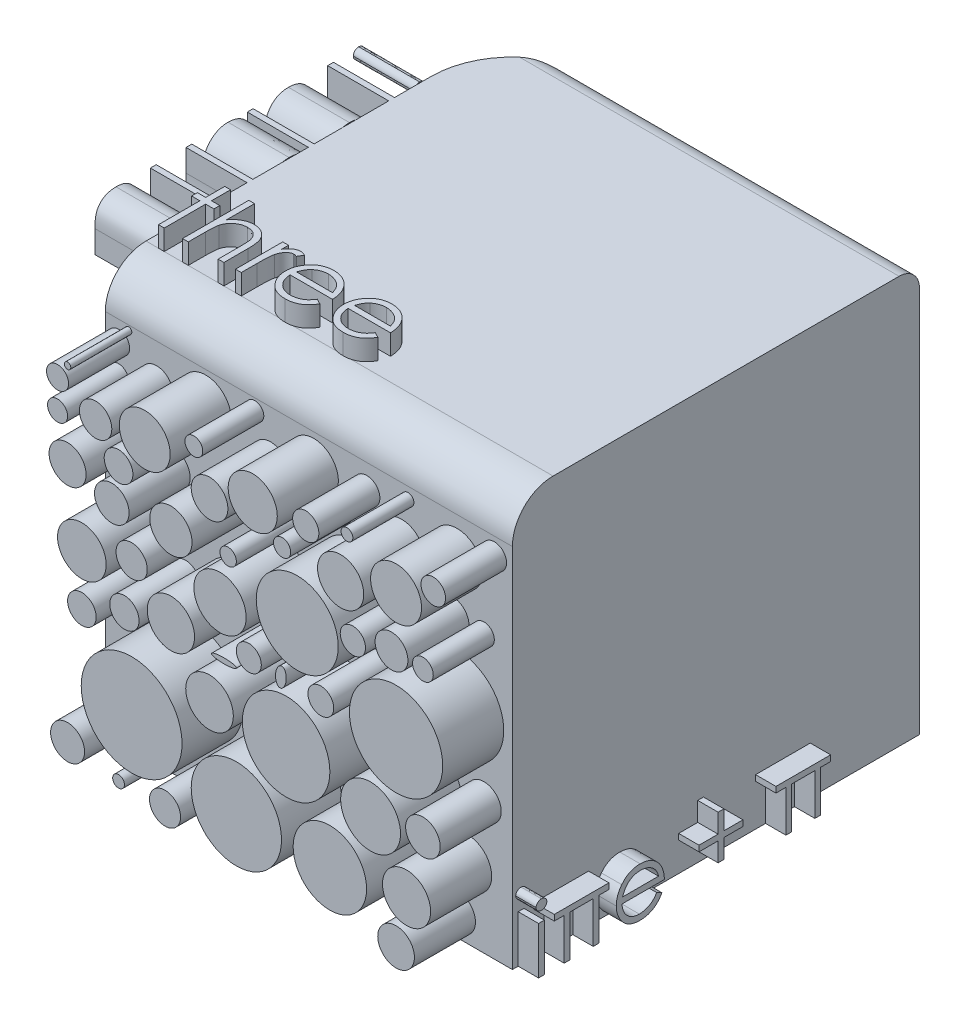
from build123d import *
from OCP.BRepFilletAPI import BRepFilletAPI_MakeFillet

# Parameters (mm, degrees)
SKETCH2_W           = 20
SKETCH2_H           = 20
BOSS_EXTRUDE1_DEPTH = 20
SKETCH3_W           = 0.284935898
SKETCH3_H           = 2.320192308
BOSS_EXTRUDE2_DEPTH = 1
FILLET1_R1          = 2
FILLET1_R2          = 1
FILLET1_R3          = 4
BOSS_EXTRUDE3_DEPTH = 1
SKETCH5_R           = 0.869274054
SKETCH5_R_2         = 1.87334708
SKETCH5_R_3         = 1.224259222
SKETCH5_R_4         = 0.854359486
SKETCH5_R_5         = 0.723058737
SKETCH5_R_6         = 0.828150602
SKETCH5_R_7         = 1.20534194
SKETCH5_R_8         = 2.196982283
SKETCH5_R_9         = 1.648859169
SKETCH5_R_10        = 0.887298728
SKETCH5_R_11        = 1.198491665
SKETCH5_R_12        = 1.240938395
SKETCH5_R_13        = 1.52286101
SKETCH5_R_14        = 2.08407997
SKETCH5_R_15        = 1.116428312
SKETCH5_R_16        = 0.510356374
SKETCH5_R_17        = 0.928303522
SKETCH5_R_18        = 1.048285303
SKETCH5_R_19        = 1.120954627
SKETCH5_R_20        = 1.035138007
SKETCH5_R_21        = 1.063032749
SKETCH5_R_22        = 0.901829478
SKETCH5_R_23        = 0.83084329
SKETCH5_R_24        = 0.806786337
SKETCH5_R_25        = 0.775997991
SKETCH5_R_26        = 0.848871038
SKETCH5_R_27        = 0.739481873
SKETCH5_R_28        = 1.066466648
SKETCH5_R_29        = 0.843889534
SKETCH5_R_30        = 0.704115082
SKETCH5_R_31        = 0.319725843
SKETCH5_R_32        = 0.681387214
SKETCH5_R_33        = 0.790534868
SKETCH5_R_34        = 0.573713006
SKETCH5_R_35        = 0.533233324
SKETCH5_R_36        = 0.625054899
SKETCH5_R_37        = 0.340042365
SKETCH5_R_38        = 0.519725647
SKETCH5_R_39        = 0.813729973
SKETCH5_R_40        = 0.720290961
SKETCH5_R_41        = 0.811333119
SKETCH5_R_42        = 0.907849135
SKETCH5_R_43        = 0.760866236
SKETCH5_R_44        = 0.443440105
SKETCH5_R_45        = 0.505502597
SKETCH5_R_46        = 0.653372918
SKETCH5_R_47        = 0.821463246
SKETCH5_R_48        = 0.243410693
SKETCH5_R_49        = 0.331818637
SKETCH5_R_50        = 0.58557289
SKETCH5_R_51        = 0.913548579
SKETCH5_R_52        = 0.618089992
SKETCH5_R_53        = 0.33645039
SKETCH5_R_54        = 0.353045631
SKETCH5_R_55        = 0.558214156
SKETCH5_R_56        = 0.708578995
SKETCH5_R_57        = 0.386937988
SKETCH5_R_58        = 0.620695254
SKETCH5_R_59        = 0.450911284
SKETCH5_R_60        = 0.446571325
SKETCH5_R_61        = 0.637073751
SKETCH5_R_62        = 0.354108624
SKETCH5_R_63        = 0.719749999
SKETCH5_RX          = 0.571418379
SKETCH5_RY          = 0.334928494
BOSS_EXTRUDE4_DEPTH = 4
SKETCH6_R           = 0.794272448
SKETCH6_R_2         = 0.85045789
SKETCH6_R_3         = 0.901030327
SKETCH6_R_4         = 1.16174239
SKETCH6_R_5         = 1.038098205
SKETCH6_R_6         = 2.014765062
SKETCH6_R_7         = 2.14961737
SKETCH6_R_8         = 2.477089822
SKETCH6_R_9         = 1.183351901
SKETCH6_R_10        = 2.217815956
SKETCH6_R_11        = 1.803840094
SKETCH6_R_12        = 1.195092222
SKETCH6_R_13        = 0.702366469
SKETCH6_R_14        = 1.252556633
SKETCH6_R_15        = 2.290309651
SKETCH6_R_16        = 1.471259211
SKETCH6_R_17        = 1.284780558
SKETCH6_R_18        = 1.169284811
SKETCH6_R_19        = 0.719100487
SKETCH6_R_20        = 0.910166483
SKETCH6_R_21        = 1.250904183
SKETCH6_R_22        = 0.643183028
SKETCH6_R_23        = 1.207146771
SKETCH6_R_24        = 1.133501294
SKETCH6_R_25        = 0.806547414
SKETCH6_R_26        = 0.403167986
SKETCH6_R_27        = 0.767115422
SKETCH6_R_28        = 0.492725753
SKETCH6_R_29        = 0.157493034
SKETCH6_R_30        = 0.541714877
SKETCH6_R_31        = 0.436948105
SKETCH6_R_32        = 0.614399725
SKETCH6_R_33        = 0.834280538
SKETCH6_R_34        = 0.764414303
SKETCH6_R_35        = 0.289432363
SKETCH6_R_36        = 0.90045624
SKETCH6_R_37        = 0.84902596
SKETCH6_R_38        = 0.633160864
SKETCH6_R_39        = 0.705305254
SKETCH6_R_40        = 0.508480831
SKETCH6_R_41        = 0.621454766
SKETCH6_R_42        = 0.603096786
SKETCH6_R_43        = 0.422088862
SKETCH6_RX          = 0.486141315
SKETCH6_RY          = 0.259275368
SKETCH6_RX_2        = 0.611023877
SKETCH6_RY_2        = 0.128636606
BOSS_EXTRUDE5_DEPTH = 3
SKETCH8_W           = 0.284935897
SKETCH8_H           = 3.256410256
BOSS_EXTRUDE6_DEPTH = 1
BOSS_EXTRUDE7_DEPTH = 3


with BuildPart() as part:
    # Sketch2 → Boss-Extrude1 (new body)
    with BuildSketch(Plane(origin=(0, 0, 0), x_dir=(1, 0, 0), z_dir=(0, 1, 0))):
        with Locations((10, -10)):
            Rectangle(SKETCH2_W, SKETCH2_H)
    extrude(amount=BOSS_EXTRUDE1_DEPTH)

    # Sketch3 → Boss-Extrude2 (add)
    # profile 1 of 6: a face of its own
    with BuildSketch(Plane(origin=(20, 0, 0), x_dir=(0, 0, -1), z_dir=(1, 0, 0))):
        with BuildLine():
            add(Edge.make_bspline(
                [(-19.573868189, 3.297115385), (-19.556186781, 3.296295189), (-19.521563189, 3.294689089), (-19.47149501, 3.280935463), (-19.425904721, 3.257622177), (-19.385466349, 3.226344181), (-19.350766423, 3.189560043), (-19.326472493, 3.146687593), (-19.310858391, 3.100370114), (-19.308972844, 3.06806214), (-19.308012821, 3.05161258)],
                knots=[0, 0, 0, 0, 1.055194115, 2.066272739, 3.074728998, 4.095836921, 5.109056067, 6.073838105, 7.019297344, 8, 8, 8, 8], degree=3))
            add(Edge.make_bspline(
                [(-19.308012821, 3.05161258), (-19.308994494, 3.03559003), (-19.310935147, 3.003915346), (-19.326460432, 2.958400839), (-19.350973462, 2.916124096), (-19.385444098, 2.879411381), (-19.425910617, 2.848150675), (-19.471493444, 2.824832805), (-19.521563601, 2.811080395), (-19.55618692, 2.809474127), (-19.573868189, 2.808653846)],
                knots=[0, 0, 0, 0, 0.96129708, 1.900370562, 2.859976407, 3.87933698, 4.906634145, 5.921202961, 6.938410037, 8, 8, 8, 8], degree=3))
            add(Edge.make_bspline(
                [(-19.573868189, 2.808653846), (-19.591347267, 2.809442807), (-19.625368009, 2.810978415), (-19.674686502, 2.825102646), (-19.71988806, 2.848158655), (-19.760405299, 2.879206694), (-19.794178403, 2.916349565), (-19.818760455, 2.958375039), (-19.834249885, 3.003921915), (-19.836195369, 3.035592237), (-19.837179487, 3.05161258)],
                knots=[0, 0, 0, 0, 1.054934014, 2.053291228, 3.073705704, 4.106921865, 5.123545215, 6.088680038, 7.033164197, 8, 8, 8, 8], degree=3))
            add(Edge.make_bspline(
                [(-19.837179487, 3.05161258), (-19.83621693, 3.068059851), (-19.834326407, 3.100363328), (-19.818748845, 3.146713822), (-19.794383162, 3.189332756), (-19.760382936, 3.226548745), (-19.719894012, 3.257614247), (-19.674684964, 3.280665637), (-19.625368416, 3.294791066), (-19.591347405, 3.296326509), (-19.573868189, 3.297115385)],
                knots=[0, 0, 0, 0, 0.98631895, 1.937192651, 2.907499808, 3.917963147, 4.944918757, 5.95915025, 6.951458133, 8, 8, 8, 8], degree=3))
        make_face()
    # profile 2 of 6: a face of its own
    with BuildSketch(Plane(origin=(20, 0, 0), x_dir=(0, 0, -1), z_dir=(1, 0, 0))):
        with Locations((-19.572596154, 1.160096154)):
            Rectangle(SKETCH3_W, SKETCH3_H)
    # profile 3 of 6: a face of its own
    with BuildSketch(Plane(origin=(20, 0, 0), x_dir=(0, 0, -1), z_dir=(1, 0, 0))):
        Polygon((-16.256585145, 2.03525641), (-16.745046683, 2.03525641), (-16.745046683, 0), (-17.029982581, 0), (-17.029982581, 2.03525641), (-18.169726171, 2.03525641), (-18.169726171, 0), (-18.454662068, 0), (-18.454662068, 2.03525641), (-18.943123606, 2.03525641), (-18.943123606, 2.320192308), (-16.256585145, 2.320192308), align=None)
    # profile 4 of 6: a face of its own
    with BuildSketch(Plane(origin=(20, 0, 0), x_dir=(0, 0, -1), z_dir=(1, 0, 0))):
        with BuildLine():
            Line((-13.909152811, 0.732692308), (-13.656017795, 0.599764623))
            add(Edge.make_bspline(
                [(-13.656017795, 0.599764623), (-13.676189563, 0.563983887), (-13.715435837, 0.494368744), (-13.782927944, 0.398726985), (-13.853677895, 0.312686557), (-13.930879352, 0.238546085), (-14.012222561, 0.1739109), (-14.098158612, 0.117361587), (-14.189134897, 0.069175501), (-14.285155718, 0.028578565), (-14.387027454, -0.002635762), (-14.494996972, -0.024683162), (-14.609271115, -0.038311413), (-14.687599435, -0.039894505), (-14.727707498, -0.040705128)],
                knots=[0, 0, 0, 0, 1.120438281, 2.179929193, 3.190490725, 4.156257408, 5.095198341, 6.022838206, 6.959905092, 7.901321166, 8.864066838, 9.862729781, 10.905609505, 12, 12, 12, 12], degree=3))
            add(Edge.make_bspline(
                [(-14.727707498, -0.040705128), (-14.772286292, -0.039664476), (-14.859246605, -0.037634466), (-14.985829089, -0.020133445), (-15.10500899, 0.008416481), (-15.216779607, 0.048299508), (-15.320867222, 0.100394295), (-15.417478712, 0.163857539), (-15.507122139, 0.238363227), (-15.586972671, 0.324556715), (-15.658858193, 0.416796776), (-15.722290902, 0.5129139), (-15.775320143, 0.612666254), (-15.818457153, 0.7154188), (-15.853295852, 0.820523904), (-15.877577076, 0.928937878), (-15.891574062, 1.040367301), (-15.893718952, 1.115748455), (-15.894799846, 1.153735978)],
                knots=[0, 0, 0, 0, 1.145258523, 2.234067595, 3.276747158, 4.290159414, 5.277019952, 6.260822364, 7.254936242, 8.264827045, 9.274100331, 10.257902744, 11.220704747, 12.172965371, 13.118907548, 14.062713208, 15.023725156, 16, 16, 16, 16], degree=3))
            add(Edge.make_bspline(
                [(-15.894799846, 1.153735978), (-15.893839054, 1.189382002), (-15.89193489, 1.260027716), (-15.879932675, 1.364590031), (-15.858661724, 1.466215842), (-15.829473201, 1.564989591), (-15.791780285, 1.660745898), (-15.745668201, 1.753543042), (-15.691065115, 1.843282276), (-15.648907761, 1.899890833), (-15.627672442, 1.928405449)],
                knots=[0, 0, 0, 0, 1.024358464, 2.0301432, 3.019427413, 4.004406732, 4.986367066, 5.972626655, 6.978780325, 8, 8, 8, 8], degree=3))
            add(Edge.make_bspline(
                [(-15.627672442, 1.928405449), (-15.598909044, 1.962757924), (-15.5422934, 2.030374674), (-15.446538706, 2.119218727), (-15.342852099, 2.193644152), (-15.232532981, 2.25533634), (-15.11429918, 2.302211719), (-14.989740037, 2.337143598), (-14.857437256, 2.356717936), (-14.766990377, 2.359482757), (-14.720711304, 2.360897436)],
                knots=[0, 0, 0, 0, 1.030682036, 2.02871468, 2.997146059, 3.962720338, 4.930598197, 5.918074684, 6.934738563, 8, 8, 8, 8], degree=3))
            add(Edge.make_bspline(
                [(-14.720711304, 2.360897436), (-14.673133834, 2.35966912), (-14.579797682, 2.357259445), (-14.443697115, 2.334919842), (-14.314918465, 2.299493596), (-14.193513265, 2.249461229), (-14.079469206, 2.18490935), (-13.973527575, 2.104952108), (-13.87387656, 2.012044272), (-13.815902349, 1.940594789), (-13.786401409, 1.904236779)],
                knots=[0, 0, 0, 0, 1.056321875, 2.072262726, 3.055038591, 4.01806755, 4.982017516, 5.957941055, 6.960871419, 8, 8, 8, 8], degree=3))
            add(Edge.make_bspline(
                [(-13.786401409, 1.904236779), (-13.766329115, 1.876837816), (-13.726318134, 1.822222265), (-13.676201121, 1.733167001), (-13.632696913, 1.639993819), (-13.597923441, 1.541196621), (-13.56976618, 1.437946002), (-13.549394637, 1.329503836), (-13.537447911, 1.215902417), (-13.535099593, 1.138499042), (-13.53390241, 1.099038462)],
                knots=[0, 0, 0, 0, 0.94817472, 1.890038105, 2.849395472, 3.817997239, 4.812318967, 5.836947057, 6.897266129, 8, 8, 8, 8], degree=3))
            Line((-13.53390241, 1.099038462), (-15.609863949, 1.099038462))
            add(Edge.make_bspline(
                [(-15.609863949, 1.099038462), (-15.608467306, 1.068467326), (-15.605720864, 1.008350421), (-15.592916412, 0.920384068), (-15.572733596, 0.836588251), (-15.544368089, 0.757591491), (-15.510017451, 0.682362018), (-15.467938979, 0.611457885), (-15.417738098, 0.545202048), (-15.361744071, 0.483001859), (-15.29941692, 0.427611026), (-15.233846142, 0.378034057), (-15.164092694, 0.336481837), (-15.090706576, 0.302754366), (-15.013806456, 0.276350779), (-14.933368108, 0.258327828), (-14.849549816, 0.246256381), (-14.792412758, 0.244914113), (-14.763324485, 0.244230769)],
                knots=[0, 0, 0, 0, 1.094153842, 2.151609401, 3.174256925, 4.172055639, 5.149267565, 6.128595816, 7.11444997, 8.118368179, 9.117203808, 10.09244225, 11.054858984, 12.015122123, 12.976791628, 13.957293641, 14.960065497, 16, 16, 16, 16], degree=3))
            add(Edge.make_bspline(
                [(-14.763324485, 0.244230769), (-14.734884516, 0.244782363), (-14.678454161, 0.245876832), (-14.594415669, 0.256519351), (-14.511739097, 0.273728102), (-14.430766634, 0.297214021), (-14.353141652, 0.325858737), (-14.281254617, 0.360423472), (-14.21514185, 0.398659314), (-14.153350031, 0.442392376), (-14.093414201, 0.495921231), (-14.033957803, 0.56271935), (-13.970206839, 0.641720179), (-13.930301994, 0.701179461), (-13.909152811, 0.732692308)],
                knots=[0, 0, 0, 0, 0.99110716, 1.966546729, 2.947904876, 3.932708344, 4.903319531, 5.828989031, 6.710028674, 7.56322171, 8.463672341, 9.504779593, 10.677557249, 12, 12, 12, 12], degree=3))
        make_face()
        with BuildLine():
            add(Edge.make_bspline(
                [(-13.818838308, 1.383974359), (-13.829267388, 1.421768537), (-13.849340012, 1.494510165), (-13.891283, 1.595240115), (-13.938519326, 1.68476414), (-13.994419039, 1.762397092), (-14.057754598, 1.831343136), (-14.130911299, 1.891594282), (-14.212949574, 1.945494398), (-14.303445366, 1.990989879), (-14.399277556, 2.02971568), (-14.499613173, 2.055682749), (-14.60199131, 2.073471405), (-14.671237412, 2.075127947), (-14.706082899, 2.075961538)],
                knots=[0, 0, 0, 0, 1.154881502, 2.222775134, 3.210006277, 4.132804581, 5.035138423, 5.962687519, 6.919655026, 7.923214229, 8.944639381, 9.960483929, 10.97369054, 12, 12, 12, 12], degree=3))
            add(Edge.make_bspline(
                [(-14.706082899, 2.075961538), (-14.734521318, 2.075406665), (-14.790738094, 2.074309797), (-14.873561206, 2.063904751), (-14.953099219, 2.046705463), (-15.029939015, 2.023151538), (-15.10307366, 1.991756592), (-15.174007485, 1.954941807), (-15.240936845, 1.910000514), (-15.282793592, 1.875747838), (-15.303939469, 1.85844351)],
                knots=[0, 0, 0, 0, 1.04873581, 2.073130211, 3.073294108, 4.04793562, 5.032784715, 6.005352987, 6.992311501, 8, 8, 8, 8], degree=3))
            add(Edge.make_bspline(
                [(-15.303939469, 1.85844351), (-15.319082661, 1.844750809), (-15.34972879, 1.81704012), (-15.390677691, 1.769297911), (-15.429884835, 1.717816137), (-15.465566077, 1.660625203), (-15.498293602, 1.598376353), (-15.528918724, 1.531594641), (-15.55648354, 1.459773302), (-15.571992154, 1.409724017), (-15.57997112, 1.383974359)],
                knots=[0, 0, 0, 0, 0.879870761, 1.780643979, 2.707998968, 3.669668524, 4.684282772, 5.740141944, 6.837334558, 8, 8, 8, 8], degree=3))
            Line((-15.57997112, 1.383974359), (-13.818838308, 1.383974359))
        make_face(mode=Mode.SUBTRACT)
    # profile 5 of 6: a face of its own
    with BuildSketch(Plane(origin=(20, 0, 0), x_dir=(0, 0, -1), z_dir=(1, 0, 0))):
        Polygon((-10.894403598, 1.709615385), (-10.894403598, 2.645833333), (-10.6094677, 2.645833333), (-10.6094677, 1.709615385), (-9.673249751, 1.709615385), (-9.673249751, 1.424679487), (-10.6094677, 1.424679487), (-10.6094677, 0.488461538), (-10.894403598, 0.488461538), (-10.894403598, 1.424679487), (-11.830621546, 1.424679487), (-11.830621546, 1.709615385), align=None)
    # profile 6 of 6: a face of its own
    with BuildSketch(Plane(origin=(20, 0, 0), x_dir=(0, 0, -1), z_dir=(1, 0, 0))):
        Polygon((-5.364587302, 2.03525641), (-5.85304884, 2.03525641), (-5.85304884, 0), (-6.137984738, 0), (-6.137984738, 2.03525641), (-7.277728327, 2.03525641), (-7.277728327, 0), (-7.562664225, 0), (-7.562664225, 2.03525641), (-8.051125763, 2.03525641), (-8.051125763, 2.320192308), (-5.364587302, 2.320192308), align=None)
    extrude(amount=BOSS_EXTRUDE2_DEPTH)

    # Fillet1: one fillet with a radius per group of edges: ONE call of the kernel's fillet builder (fillet() takes one radius for all edges)
    fillet1_edges_1 = [part.edges().sort_by_distance(p)[0] for p in [
        (10, 20, 20),
    ]]
    fillet1_edges_2 = [part.edges().sort_by_distance(p)[0] for p in [
        (10, 20, 0),
    ]]
    fillet1_edges_3 = [part.edges().sort_by_distance(p)[0] for p in [
        (0, 10, 0),
    ]]
    fillet1 = BRepFilletAPI_MakeFillet(part.part.solid().wrapped)
    for e in fillet1_edges_1:
        fillet1.Add(FILLET1_R1, e.wrapped)
    for e in fillet1_edges_2:
        fillet1.Add(FILLET1_R2, e.wrapped)
    for e in fillet1_edges_3:
        fillet1.Add(FILLET1_R3, e.wrapped)
    add(Compound.cast(fillet1.Shape()), mode=Mode.REPLACE)

    # Sketch4 → Boss-Extrude3 (add)
    # profile 1 of 5: a face of its own
    with BuildSketch(Plane(origin=(0, 20, 0), x_dir=(1, 0, 0), z_dir=(0, 1, 0))):
        Polygon((0.610576923, -14.743589744), (0.895512821, -14.743589744), (0.895512821, -15.679807692), (1.302564103, -15.679807692), (1.302564103, -15.96474359), (0.895512821, -15.96474359), (0.895512821, -18), (0.610576923, -18), (0.610576923, -15.96474359), (0.203525641, -15.96474359), (0.203525641, -15.679807692), (0.610576923, -15.679807692), align=None)
    # profile 2 of 5: a face of its own
    with BuildSketch(Plane(origin=(0, 20, 0), x_dir=(1, 0, 0), z_dir=(0, 1, 0))):
        with BuildLine():
            Line((1.791025641, -14.743589744), (2.075961538, -14.743589744))
            Line((2.075961538, -14.743589744), (2.075961538, -16.118023838))
            add(Edge.make_bspline(
                [(2.075961538, -16.118023838), (2.106547948, -16.079793226), (2.166101254, -16.005356265), (2.266337017, -15.90823647), (2.369271308, -15.824054864), (2.478459386, -15.757043806), (2.591898072, -15.704106085), (2.710065807, -15.666561577), (2.832984545, -15.643473796), (2.916464502, -15.640572374), (2.958754006, -15.639102564)],
                knots=[0, 0, 0, 0, 1.125788106, 2.19196713, 3.20547328, 4.180437432, 5.132270164, 6.079753143, 7.027236121, 8, 8, 8, 8], degree=3))
            add(Edge.make_bspline(
                [(2.958754006, -15.639102564), (3.001689434, -15.640685919), (3.085724423, -15.643784926), (3.208081178, -15.668289921), (3.322345686, -15.710161311), (3.428178272, -15.767462827), (3.523269248, -15.83883032), (3.607497248, -15.921227487), (3.676295687, -16.01672597), (3.723103457, -16.104951286), (3.753559334, -16.183454299), (3.772837777, -16.250797421), (3.789183764, -16.325838013), (3.803425667, -16.408537449), (3.81291763, -16.499292712), (3.82054182, -16.597694357), (3.825963317, -16.703736743), (3.826173416, -16.777142969), (3.826282051, -16.815099159)],
                knots=[0, 0, 0, 0, 1.235656852, 2.418478516, 3.575258207, 4.727955599, 5.870717718, 6.98870536, 8.107142894, 9.245821548, 9.854588956, 10.528768408, 11.260415777, 12.065282286, 12.943670737, 13.886611085, 14.907229059, 16, 16, 16, 16], degree=3))
            Line((3.826282051, -16.815099159), (3.826282051, -18))
            Line((3.826282051, -18), (3.541346154, -18))
            Line((3.541346154, -18), (3.541346154, -16.90859375))
            add(Edge.make_bspline(
                [(3.541346154, -16.90859375), (3.541173522, -16.877004614), (3.540843306, -16.816579973), (3.5397517, -16.730069289), (3.537314919, -16.651604938), (3.53337717, -16.581438389), (3.529235784, -16.519471821), (3.523535918, -16.465795221), (3.516904491, -16.420334868), (3.510945668, -16.392971241), (3.508273237, -16.380699119)],
                knots=[0, 0, 0, 0, 1.430932559, 2.737130458, 3.918967929, 4.986496826, 5.920444988, 6.731744033, 7.431208747, 8, 8, 8, 8], degree=3))
            add(Edge.make_bspline(
                [(3.508273237, -16.380699119), (3.497909815, -16.344690751), (3.477986196, -16.275464874), (3.431678388, -16.181428259), (3.373839856, -16.101250672), (3.303221269, -16.03601414), (3.221071896, -15.984840815), (3.126856071, -15.949400755), (3.021460524, -15.927404607), (2.947209546, -15.925191811), (2.908508614, -15.924038462)],
                knots=[0, 0, 0, 0, 1.090059168, 2.095632401, 3.037101401, 3.955032261, 4.878929692, 5.839099886, 6.873700383, 8, 8, 8, 8], degree=3))
            add(Edge.make_bspline(
                [(2.908508614, -15.924038462), (2.885587134, -15.924470104), (2.840226117, -15.925324313), (2.772962685, -15.93390035), (2.707712748, -15.947914544), (2.643847916, -15.966877947), (2.582721729, -15.992682113), (2.522552463, -16.022554499), (2.465044859, -16.059119844), (2.409177725, -16.100146076), (2.357182534, -16.145566501), (2.308807222, -16.193506239), (2.265683157, -16.244555671), (2.226613792, -16.297895776), (2.192887776, -16.354258189), (2.163448194, -16.413099392), (2.138469384, -16.474496767), (2.126057227, -16.517109858), (2.119846755, -16.53843149)],
                knots=[0, 0, 0, 0, 1.024319606, 2.027102035, 3.025350316, 4.005802111, 5.00026367, 5.987881639, 7.005602596, 8.042517216, 9.083927026, 10.089214625, 11.084353441, 12.06828073, 13.041928858, 14.016821737, 15.00770877, 16, 16, 16, 16], degree=3))
            add(Edge.make_bspline(
                [(2.119846755, -16.53843149), (2.116273132, -16.553871924), (2.108485767, -16.587518531), (2.100035882, -16.643012382), (2.092472309, -16.707497876), (2.086078268, -16.780877207), (2.082156611, -16.863419262), (2.077930921, -16.954560775), (2.076357923, -17.054872651), (2.076097615, -17.124627861), (2.075961538, -17.161092748)],
                knots=[0, 0, 0, 0, 0.607992626, 1.324890765, 2.152360218, 3.099583803, 4.150613268, 5.323148443, 6.60066238, 8, 8, 8, 8], degree=3))
            Line((2.075961538, -17.161092748), (2.075961538, -18))
            Line((2.075961538, -18), (1.791025641, -18))
            Line((1.791025641, -18), (1.791025641, -14.743589744))
        make_face()
    # profile 3 of 5: a face of its own
    with BuildSketch(Plane(origin=(0, 20, 0), x_dir=(1, 0, 0), z_dir=(0, 1, 0))):
        with BuildLine():
            Line((4.396153846, -15.679807692), (4.681089744, -15.679807692))
            Line((4.681089744, -15.679807692), (4.681089744, -16.021349159))
            add(Edge.make_bspline(
                [(4.681089744, -16.021349159), (4.70212526, -15.989548514), (4.742355523, -15.928730029), (4.80922368, -15.848294306), (4.877715988, -15.781696371), (4.948160337, -15.728625322), (5.021074756, -15.688880564), (5.09485899, -15.659767597), (5.170673881, -15.642552461), (5.221620769, -15.64025407), (5.247145433, -15.639102564)],
                knots=[0, 0, 0, 0, 1.2804753, 2.448899062, 3.506932113, 4.484331642, 5.4025378, 6.288909075, 7.142734305, 8, 8, 8, 8], degree=3))
            add(Edge.make_bspline(
                [(5.247145433, -15.639102564), (5.266945029, -15.640182542), (5.307683985, -15.642404666), (5.369353905, -15.658017343), (5.432893323, -15.682943835), (5.473843917, -15.706384608), (5.495192308, -15.718604768)],
                knots=[0, 0, 0, 0, 0.901110191, 1.854092781, 2.881294221, 4, 4, 4, 4], degree=3))
            Line((5.495192308, -15.718604768), (5.338731971, -15.965379607))
            add(Edge.make_bspline(
                [(5.338731971, -15.965379607), (5.325025931, -15.959265223), (5.299009242, -15.947658951), (5.260950457, -15.933922985), (5.225860958, -15.925834976), (5.20350573, -15.924609682), (5.193083934, -15.924038462)],
                knots=[0, 0, 0, 0, 1.180555205, 2.24091978, 3.179933427, 4, 4, 4, 4], degree=3))
            add(Edge.make_bspline(
                [(5.193083934, -15.924038462), (5.170218733, -15.925562495), (5.123580351, -15.928671083), (5.055105126, -15.95310843), (4.988659447, -15.992592041), (4.935889439, -16.036380835), (4.895029681, -16.078606337), (4.865873905, -16.115480245), (4.839128842, -16.156826575), (4.813574428, -16.201938502), (4.790291432, -16.251586291), (4.768561125, -16.305273921), (4.748913442, -16.363063573), (4.737710006, -16.403324859), (4.731971154, -16.423948317)],
                knots=[0, 0, 0, 0, 1.125678352, 2.296057538, 3.5422874, 4.923748041, 5.663163013, 6.437101912, 7.23742474, 8.08941207, 8.991984279, 9.93940061, 10.944477711, 12, 12, 12, 12], degree=3))
            add(Edge.make_bspline(
                [(4.731971154, -16.423948317), (4.727678197, -16.44234261), (4.718169624, -16.483084572), (4.708924443, -16.551436448), (4.699789952, -16.632193624), (4.693352305, -16.725580891), (4.687385081, -16.831365036), (4.684019507, -16.949707215), (4.681204515, -17.080728898), (4.681129161, -17.172327062), (4.681089744, -17.220242388)],
                knots=[0, 0, 0, 0, 0.566838948, 1.255505196, 2.06880316, 3.007127437, 4.065329342, 5.249902469, 6.561414163, 8, 8, 8, 8], degree=3))
            Line((4.681089744, -17.220242388), (4.681089744, -18))
            Line((4.681089744, -18), (4.396153846, -18))
            Line((4.396153846, -18), (4.396153846, -15.679807692))
        make_face()
    # profile 4 of 5: a face of its own
    with BuildSketch(Plane(origin=(0, 20, 0), x_dir=(1, 0, 0), z_dir=(0, 1, 0))):
        with BuildLine():
            Line((7.684364984, -17.267307692), (7.9375, -17.400235377))
            add(Edge.make_bspline(
                [(7.9375, -17.400235377), (7.917328231, -17.436016113), (7.878081958, -17.505631256), (7.810589851, -17.601273015), (7.739839899, -17.687313443), (7.662638443, -17.761453915), (7.581295234, -17.8260891), (7.495359183, -17.882638413), (7.404382898, -17.930824499), (7.308362076, -17.971421435), (7.206490341, -18.002635762), (7.098520822, -18.024683162), (6.98424668, -18.038311413), (6.90591836, -18.039894505), (6.865810296, -18.040705128)],
                knots=[0, 0, 0, 0, 1.120438281, 2.179929193, 3.190490725, 4.156257408, 5.095198341, 6.022838206, 6.959905092, 7.901321166, 8.864066838, 9.862729781, 10.905609505, 12, 12, 12, 12], degree=3))
            add(Edge.make_bspline(
                [(6.865810296, -18.040705128), (6.821231503, -18.039664476), (6.73427119, -18.037634466), (6.607688705, -18.020133445), (6.488508804, -17.991583519), (6.376738188, -17.951700492), (6.272650573, -17.899605705), (6.176039083, -17.836142461), (6.086395656, -17.761636773), (6.006545124, -17.675443285), (5.934659601, -17.583203224), (5.871226893, -17.4870861), (5.818197652, -17.387333746), (5.775060642, -17.2845812), (5.740221943, -17.179476096), (5.715940718, -17.071062122), (5.701943733, -16.959632699), (5.699798843, -16.884251545), (5.698717949, -16.846264022)],
                knots=[0, 0, 0, 0, 1.145258523, 2.234067595, 3.276747158, 4.290159414, 5.277019952, 6.260822364, 7.254936242, 8.264827045, 9.274100331, 10.257902744, 11.220704747, 12.172965371, 13.118907548, 14.062713208, 15.023725156, 16, 16, 16, 16], degree=3))
            add(Edge.make_bspline(
                [(5.698717949, -16.846264022), (5.699678741, -16.810617998), (5.701582905, -16.739972284), (5.713585119, -16.635409969), (5.734856071, -16.533784158), (5.764044593, -16.435010409), (5.80173751, -16.339254102), (5.847849594, -16.246456958), (5.90245268, -16.156717724), (5.944610034, -16.100109167), (5.965845353, -16.071594551)],
                knots=[0, 0, 0, 0, 1.024358464, 2.0301432, 3.019427413, 4.004406732, 4.986367066, 5.972626655, 6.978780325, 8, 8, 8, 8], degree=3))
            add(Edge.make_bspline(
                [(5.965845353, -16.071594551), (5.994608751, -16.037242076), (6.051224395, -15.969625326), (6.146979089, -15.880781273), (6.250665695, -15.806355848), (6.360984813, -15.74466366), (6.479218615, -15.697788281), (6.603777757, -15.662856402), (6.736080539, -15.643282064), (6.826527418, -15.640517243), (6.87280649, -15.639102564)],
                knots=[0, 0, 0, 0, 1.030682036, 2.02871468, 2.997146059, 3.962720338, 4.930598197, 5.918074684, 6.934738563, 8, 8, 8, 8], degree=3))
            add(Edge.make_bspline(
                [(6.87280649, -15.639102564), (6.920383961, -15.64033088), (7.013720113, -15.642740555), (7.14982068, -15.665080158), (7.27859933, -15.700506404), (7.40000453, -15.750538771), (7.514048589, -15.81509065), (7.61999022, -15.895047892), (7.719641235, -15.987955728), (7.777615446, -16.059405211), (7.807116386, -16.095763221)],
                knots=[0, 0, 0, 0, 1.056321875, 2.072262726, 3.055038591, 4.01806755, 4.982017516, 5.957941055, 6.960871419, 8, 8, 8, 8], degree=3))
            add(Edge.make_bspline(
                [(7.807116386, -16.095763221), (7.82718868, -16.123162184), (7.867199661, -16.177777735), (7.917316673, -16.266832999), (7.960820882, -16.360006181), (7.995594353, -16.458803379), (8.023751615, -16.562053998), (8.044123158, -16.670496164), (8.056069883, -16.784097583), (8.058418202, -16.861500958), (8.059615385, -16.900961538)],
                knots=[0, 0, 0, 0, 0.94817472, 1.890038105, 2.849395472, 3.817997239, 4.812318967, 5.836947057, 6.897266129, 8, 8, 8, 8], degree=3))
            Line((8.059615385, -16.900961538), (5.983653846, -16.900961538))
            add(Edge.make_bspline(
                [(5.983653846, -16.900961538), (5.985050489, -16.931532674), (5.987796931, -16.991649579), (6.000601383, -17.079615932), (6.020784199, -17.163411749), (6.049149706, -17.242408509), (6.083500344, -17.317637982), (6.125578815, -17.388542115), (6.175779696, -17.454797952), (6.231773724, -17.516998141), (6.294100875, -17.572388974), (6.359671652, -17.621965943), (6.429425101, -17.663518163), (6.502811219, -17.697245634), (6.579711339, -17.723649221), (6.660149687, -17.741672172), (6.743967978, -17.753743619), (6.801105037, -17.755085887), (6.830193309, -17.755769231)],
                knots=[0, 0, 0, 0, 1.094153842, 2.151609401, 3.174256925, 4.172055639, 5.149267565, 6.128595816, 7.11444997, 8.118368179, 9.117203808, 10.09244225, 11.054858984, 12.015122123, 12.976791628, 13.957293641, 14.960065497, 16, 16, 16, 16], degree=3))
            add(Edge.make_bspline(
                [(6.830193309, -17.755769231), (6.858633279, -17.755217637), (6.915063634, -17.754123168), (6.999102126, -17.743480649), (7.081778698, -17.726271898), (7.162751161, -17.702785979), (7.240376143, -17.674141263), (7.312263177, -17.639576528), (7.378375944, -17.601340686), (7.440167764, -17.557607624), (7.500103594, -17.504078769), (7.559559992, -17.43728065), (7.623310956, -17.358279821), (7.663215801, -17.298820539), (7.684364984, -17.267307692)],
                knots=[0, 0, 0, 0, 0.99110716, 1.966546729, 2.947904876, 3.932708344, 4.903319531, 5.828989031, 6.710028674, 7.56322171, 8.463672341, 9.504779593, 10.677557249, 12, 12, 12, 12], degree=3))
        make_face()
        with BuildLine():
            add(Edge.make_bspline(
                [(7.774679487, -16.616025641), (7.764250406, -16.578231463), (7.744177783, -16.505489835), (7.702234795, -16.404759885), (7.654998469, -16.31523586), (7.599098755, -16.237602908), (7.535763197, -16.168656864), (7.462606496, -16.108405718), (7.380568221, -16.054505602), (7.290072429, -16.009010121), (7.194240238, -15.97028432), (7.093904621, -15.944317251), (6.991526485, -15.926528595), (6.922280383, -15.924872053), (6.887434896, -15.924038462)],
                knots=[0, 0, 0, 0, 1.154881502, 2.222775134, 3.210006277, 4.132804581, 5.035138423, 5.962687519, 6.919655026, 7.923214229, 8.944639381, 9.960483929, 10.97369054, 12, 12, 12, 12], degree=3))
            add(Edge.make_bspline(
                [(6.887434896, -15.924038462), (6.858996477, -15.924593335), (6.802779701, -15.925690203), (6.719956589, -15.936095249), (6.640418576, -15.953294537), (6.56357878, -15.976848462), (6.490444135, -16.008243408), (6.419510309, -16.045058193), (6.35258095, -16.089999486), (6.310724203, -16.124252162), (6.289578325, -16.14155649)],
                knots=[0, 0, 0, 0, 1.04873581, 2.073130211, 3.073294108, 4.04793562, 5.032784715, 6.005352987, 6.992311501, 8, 8, 8, 8], degree=3))
            add(Edge.make_bspline(
                [(6.289578325, -16.14155649), (6.274435134, -16.155249191), (6.243789005, -16.18295988), (6.202840103, -16.230702089), (6.16363296, -16.282183863), (6.127951718, -16.339374797), (6.095224193, -16.401623647), (6.064599071, -16.468405359), (6.037034254, -16.540226698), (6.02152564, -16.590275983), (6.013546675, -16.616025641)],
                knots=[0, 0, 0, 0, 0.879870761, 1.780643979, 2.707998968, 3.669668524, 4.684282772, 5.740141944, 6.837334558, 8, 8, 8, 8], degree=3))
            Line((6.013546675, -16.616025641), (7.774679487, -16.616025641))
        make_face(mode=Mode.SUBTRACT)
    # profile 5 of 5: a face of its own
    with BuildSketch(Plane(origin=(0, 20, 0), x_dir=(1, 0, 0), z_dir=(0, 1, 0))):
        with BuildLine():
            Line((10.533723958, -17.267307692), (10.786858974, -17.400235377))
            add(Edge.make_bspline(
                [(10.786858974, -17.400235377), (10.766687206, -17.436016113), (10.727440932, -17.505631256), (10.659948825, -17.601273015), (10.589198874, -17.687313443), (10.511997417, -17.761453915), (10.430654208, -17.8260891), (10.344718157, -17.882638413), (10.253741873, -17.930824499), (10.157721051, -17.971421435), (10.055849315, -18.002635762), (9.947879797, -18.024683162), (9.833605654, -18.038311413), (9.755277334, -18.039894505), (9.715169271, -18.040705128)],
                knots=[0, 0, 0, 0, 1.120438281, 2.179929193, 3.190490725, 4.156257408, 5.095198341, 6.022838206, 6.959905092, 7.901321166, 8.864066838, 9.862729781, 10.905609505, 12, 12, 12, 12], degree=3))
            add(Edge.make_bspline(
                [(9.715169271, -18.040705128), (9.670590477, -18.039664476), (9.583630165, -18.037634466), (9.45704768, -18.020133445), (9.337867779, -17.991583519), (9.226097162, -17.951700492), (9.122009547, -17.899605705), (9.025398058, -17.836142461), (8.93575463, -17.761636773), (8.855904098, -17.675443285), (8.784018576, -17.583203224), (8.720585868, -17.4870861), (8.667556627, -17.387333746), (8.624419616, -17.2845812), (8.589580917, -17.179476096), (8.565299693, -17.071062122), (8.551302707, -16.959632699), (8.549157817, -16.884251545), (8.548076923, -16.846264022)],
                knots=[0, 0, 0, 0, 1.145258523, 2.234067595, 3.276747158, 4.290159414, 5.277019952, 6.260822364, 7.254936242, 8.264827045, 9.274100331, 10.257902744, 11.220704747, 12.172965371, 13.118907548, 14.062713208, 15.023725156, 16, 16, 16, 16], degree=3))
            add(Edge.make_bspline(
                [(8.548076923, -16.846264022), (8.549037716, -16.810617998), (8.550941879, -16.739972284), (8.562944094, -16.635409969), (8.584215045, -16.533784158), (8.613403568, -16.435010409), (8.651096484, -16.339254102), (8.697208568, -16.246456958), (8.751811654, -16.156717724), (8.793969008, -16.100109167), (8.815204327, -16.071594551)],
                knots=[0, 0, 0, 0, 1.024358464, 2.0301432, 3.019427413, 4.004406732, 4.986367066, 5.972626655, 6.978780325, 8, 8, 8, 8], degree=3))
            add(Edge.make_bspline(
                [(8.815204327, -16.071594551), (8.843967725, -16.037242076), (8.900583369, -15.969625326), (8.996338063, -15.880781273), (9.10002467, -15.806355848), (9.210343788, -15.74466366), (9.328577589, -15.697788281), (9.453136732, -15.662856402), (9.585439514, -15.643282064), (9.675886392, -15.640517243), (9.722165465, -15.639102564)],
                knots=[0, 0, 0, 0, 1.030682036, 2.02871468, 2.997146059, 3.962720338, 4.930598197, 5.918074684, 6.934738563, 8, 8, 8, 8], degree=3))
            add(Edge.make_bspline(
                [(9.722165465, -15.639102564), (9.769742935, -15.64033088), (9.863079087, -15.642740555), (9.999179654, -15.665080158), (10.127958304, -15.700506404), (10.249363504, -15.750538771), (10.363407564, -15.81509065), (10.469349194, -15.895047892), (10.569000209, -15.987955728), (10.62697442, -16.059405211), (10.656475361, -16.095763221)],
                knots=[0, 0, 0, 0, 1.056321875, 2.072262726, 3.055038591, 4.01806755, 4.982017516, 5.957941055, 6.960871419, 8, 8, 8, 8], degree=3))
            add(Edge.make_bspline(
                [(10.656475361, -16.095763221), (10.676547655, -16.123162184), (10.716558635, -16.177777735), (10.766675648, -16.266832999), (10.810179856, -16.360006181), (10.844953328, -16.458803379), (10.87311059, -16.562053998), (10.893482132, -16.670496164), (10.905428858, -16.784097583), (10.907777176, -16.861500958), (10.908974359, -16.900961538)],
                knots=[0, 0, 0, 0, 0.94817472, 1.890038105, 2.849395472, 3.817997239, 4.812318967, 5.836947057, 6.897266129, 8, 8, 8, 8], degree=3))
            Line((10.908974359, -16.900961538), (8.833012821, -16.900961538))
            add(Edge.make_bspline(
                [(8.833012821, -16.900961538), (8.834409463, -16.931532674), (8.837155906, -16.991649579), (8.849960357, -17.079615932), (8.870143173, -17.163411749), (8.89850868, -17.242408509), (8.932859318, -17.317637982), (8.97493779, -17.388542115), (9.025138671, -17.454797952), (9.081132698, -17.516998141), (9.143459849, -17.572388974), (9.209030627, -17.621965943), (9.278784075, -17.663518163), (9.352170194, -17.697245634), (9.429070313, -17.723649221), (9.509508661, -17.741672172), (9.593326953, -17.753743619), (9.650464011, -17.755085887), (9.679552284, -17.755769231)],
                knots=[0, 0, 0, 0, 1.094153842, 2.151609401, 3.174256925, 4.172055639, 5.149267565, 6.128595816, 7.11444997, 8.118368179, 9.117203808, 10.09244225, 11.054858984, 12.015122123, 12.976791628, 13.957293641, 14.960065497, 16, 16, 16, 16], degree=3))
            add(Edge.make_bspline(
                [(9.679552284, -17.755769231), (9.707992253, -17.755217637), (9.764422609, -17.754123168), (9.848461101, -17.743480649), (9.931137672, -17.726271898), (10.012110135, -17.702785979), (10.089735117, -17.674141263), (10.161622152, -17.639576528), (10.227734919, -17.601340686), (10.289526738, -17.557607624), (10.349462568, -17.504078769), (10.408918966, -17.43728065), (10.472669931, -17.358279821), (10.512574775, -17.298820539), (10.533723958, -17.267307692)],
                knots=[0, 0, 0, 0, 0.99110716, 1.966546729, 2.947904876, 3.932708344, 4.903319531, 5.828989031, 6.710028674, 7.56322171, 8.463672341, 9.504779593, 10.677557249, 12, 12, 12, 12], degree=3))
        make_face()
        with BuildLine():
            add(Edge.make_bspline(
                [(10.624038462, -16.616025641), (10.613609381, -16.578231463), (10.593536757, -16.505489835), (10.551593769, -16.404759885), (10.504357443, -16.31523586), (10.44845773, -16.237602908), (10.385122172, -16.168656864), (10.31196547, -16.108405718), (10.229927195, -16.054505602), (10.139431403, -16.009010121), (10.043599213, -15.97028432), (9.943263596, -15.944317251), (9.84088546, -15.926528595), (9.771639357, -15.924872053), (9.73679387, -15.924038462)],
                knots=[0, 0, 0, 0, 1.154881502, 2.222775134, 3.210006277, 4.132804581, 5.035138423, 5.962687519, 6.919655026, 7.923214229, 8.944639381, 9.960483929, 10.97369054, 12, 12, 12, 12], degree=3))
            add(Edge.make_bspline(
                [(9.73679387, -15.924038462), (9.708355451, -15.924593335), (9.652138675, -15.925690203), (9.569315563, -15.936095249), (9.489777551, -15.953294537), (9.412937754, -15.976848462), (9.339803109, -16.008243408), (9.268869284, -16.045058193), (9.201939924, -16.089999486), (9.160083178, -16.124252162), (9.1389373, -16.14155649)],
                knots=[0, 0, 0, 0, 1.04873581, 2.073130211, 3.073294108, 4.04793562, 5.032784715, 6.005352987, 6.992311501, 8, 8, 8, 8], degree=3))
            add(Edge.make_bspline(
                [(9.1389373, -16.14155649), (9.123794108, -16.155249191), (9.093147979, -16.18295988), (9.052199078, -16.230702089), (9.012991935, -16.282183863), (8.977310692, -16.339374797), (8.944583168, -16.401623647), (8.913958045, -16.468405359), (8.886393229, -16.540226698), (8.870884615, -16.590275983), (8.862905649, -16.616025641)],
                knots=[0, 0, 0, 0, 0.879870761, 1.780643979, 2.707998968, 3.669668524, 4.684282772, 5.740141944, 6.837334558, 8, 8, 8, 8], degree=3))
            Line((8.862905649, -16.616025641), (10.624038462, -16.616025641))
        make_face(mode=Mode.SUBTRACT)
    extrude(amount=BOSS_EXTRUDE3_DEPTH)

    # Sketch5 → Boss-Extrude4 (add)
    with BuildSketch(Plane.XY.offset(20)):
        with Locations((2.852466063, 15.587306963)):
            Circle(SKETCH5_R)
        with Locations((10.332535753, 15.280289178)):
            Circle(SKETCH5_R_2)
        with Locations((4.387554992, 9.558594078)):
            Circle(SKETCH5_R_3)
        with Locations((7.150715064, 12.46130769)):
            Circle(SKETCH5_R_4)
        with Locations((2.517537569, 13.315667175)):
            Circle(SKETCH5_R_5)
        with Locations((11.89553539, 8.334334857)):
            Circle(SKETCH5_R_6)
        with Locations((5.057411979, 5.958112772)):
            Circle(SKETCH5_R_7)
        with Locations((13.346892196, 3.836898979)):
            Circle(SKETCH5_R_8)
        with Locations((14.798249001, 13.828932372)):
            Circle(SKETCH5_R_9)
        with Locations((9.411482396, 10.7828533)):
            Circle(SKETCH5_R_10)
        with Locations((8.005074549, 8.107237273)):
            Circle(SKETCH5_R_11)
        with Locations((8.239232668, 4.752770832)):
            Circle(SKETCH5_R_12)
        with Locations((2.517537569, 2.664649252)):
            Circle(SKETCH5_R_13)
        with Locations((16.807819963, 9.162485459)):
            Circle(SKETCH5_R_14)
        with Locations((17.282301996, 3.836898979)):
            Circle(SKETCH5_R_15)
        with Locations((17.673051905, 1.639916696)):
            Circle(SKETCH5_R_16)
        with Locations((7.625197096, 1.639916696)):
            Circle(SKETCH5_R_17)
        with Locations((11.89553539, 11.670152028)):
            Circle(SKETCH5_R_18)
        with Locations((17.673051905, 16.64791386)):
            Circle(SKETCH5_R_19)
        with Locations((5.611814213, 16.456581018)):
            Circle(SKETCH5_R_20)
        with Locations((1.401109257, 7.506184255)):
            Circle(SKETCH5_R_21)
        with Locations((1.205734302, 11.246565429)):
            Circle(SKETCH5_R_22)
        with Locations((4.387554992, 13.315667175)):
            Circle(SKETCH5_R_23)
        with Locations((5.057411979, 1.966881557)):
            Circle(SKETCH5_R_24)
        with Locations((9.858053721, 6.990808961)):
            Circle(SKETCH5_R_25)
        with Locations((13.151517241, 10.144718942)):
            Circle(SKETCH5_R_26)
        with Locations((13.598088566, 7.506184255)):
            Circle(SKETCH5_R_27)
        with Locations((9.858053721, 2.134345803)):
            Circle(SKETCH5_R_28)
        with Locations((17.673051905, 13.828932372)):
            Circle(SKETCH5_R_29)
        with Locations((18.175444645, 12.014736365)):
            Circle(SKETCH5_R_30)
        with Locations((14.337570439, 11.670152028)):
            Circle(SKETCH5_R_31)
        with Locations((13.598088566, 17.038663769)):
            Circle(SKETCH5_R_32)
        with Locations((6.732054447, 14.672821906)):
            Circle(SKETCH5_R_33)
        with Locations((5.224876226, 11.670152028)):
            Circle(SKETCH5_R_34)
        with Locations((0.842895101, 17.038663769)):
            Circle(SKETCH5_R_35)
        with Locations((0.842895101, 14.672821906)):
            Circle(SKETCH5_R_36)
        with Locations((2.852466063, 17.571897093)):
            Circle(SKETCH5_R_37)
        with Locations((7.522589315, 17.231854728)):
            Circle(SKETCH5_R_38)
        with Locations((15.523927404, 1.213292446)):
            Circle(SKETCH5_R_39)
        with Locations((11.588517604, 0.878363952)):
            Circle(SKETCH5_R_40)
        with Locations((15.523927404, 6.181398435)):
            Circle(SKETCH5_R_41)
        with Locations((18.175444645, 6.181398435)):
            Circle(SKETCH5_R_42)
        with Locations((19.08329378, 2.469274297)):
            Circle(SKETCH5_R_43)
        with Locations((16.249605807, 12.014736365)):
            Circle(SKETCH5_R_44)
        with Locations((12.314196007, 13.315667175)):
            Circle(SKETCH5_R_45)
        with Locations((9.244018149, 12.46130769)):
            Circle(SKETCH5_R_46)
        with Locations((6.732054447, 10.144718942)):
            Circle(SKETCH5_R_47)
        with Locations((15.188998911, 16.64791386)):
            Circle(SKETCH5_R_41)
        with Locations((11.80869341, 17.459246979)):
            Circle(SKETCH5_R_48)
        with Locations((12.819698604, 15.587306963)):
            Circle(SKETCH5_R_49)
        with Locations((7.522589315, 15.9191256)):
            Circle(SKETCH5_R_50)
        with Locations((3.159483848, 11.670152028)):
            Circle(SKETCH5_R_51)
        with Locations((1.401109257, 9.558594078)):
            Circle(SKETCH5_R_52)
        with Locations((2.517537569, 10.17668407)):
            Circle(SKETCH5_R_53)
        with Locations((2.517537569, 8.637540721)):
            Circle(SKETCH5_R_54)
        with Locations((0.842895101, 5.511541447)):
            Circle(SKETCH5_R_55)
        with Locations((2.517537569, 5.762737818)):
            Circle(SKETCH5_R)
        with Locations((3.386811623, 7.716487364)):
            Circle(SKETCH5_R_56)
        with Locations((5.224876226, 8.107237273)):
            Circle(SKETCH5_R_57)
        with Locations((5.057411979, 3.836898979)):
            Circle(SKETCH5_R_58)
        with Locations((6.732054447, 6.739612591)):
            Circle(SKETCH5_R_59)
        with Locations((6.281143163, 4.171827473)):
            Circle(SKETCH5_R_59)
        with Locations((10.332535753, 5.511541447)):
            Circle(SKETCH5_R_60)
        with Locations((10.137160799, 4.171827473)):
            Circle(SKETCH5_R_55)
        with Locations((11.588517604, 6.739612591)):
            Circle(SKETCH5_R_61)
        with Locations((9.578946643, 9.162485459)):
            Circle(SKETCH5_R_62)
        with Locations((10.951443853, 9.893522572)):
            Circle(SKETCH5_R_63)
        with Locations((19.08329378, 4.171827473)):
            Ellipse(SKETCH5_RX, SKETCH5_RY)
    extrude(amount=-BOSS_EXTRUDE4_DEPTH)

    # Sketch6 → Boss-Extrude5 (add)
    with BuildSketch(Plane.XY.offset(20)):
        with Locations((2.524530447, 16.161052684)):
            Circle(SKETCH6_R)
        with Locations((3.318802895, 13.009455844)):
            Circle(SKETCH6_R_2)
        with Locations((8.120222795, 15.61434711)):
            Circle(SKETCH6_R_3)
        with Locations((6.22283286, 9.343312582)):
            Circle(SKETCH6_R_4)
        with Locations((6.22283286, 13.298888207)):
            Circle(SKETCH6_R_5)
        with Locations((12.429549085, 12.46275027)):
            Circle(SKETCH6_R_6)
        with Locations((11.882843511, 6.931376225)):
            Circle(SKETCH6_R_7)
        with Locations((4.293283775, 4.487280717)):
            Circle(SKETCH6_R_8)
        with Locations((17.800127373, 3.458187871)):
            Circle(SKETCH6_R_9)
        with Locations((9.438748003, 2.847163994)):
            Circle(SKETCH6_R_10)
        with Locations((14.032460882, 2.847163994)):
            Circle(SKETCH6_R_11)
        with Locations((1.849188267, 10.243768822)):
            Circle(SKETCH6_R_12)
        with Locations((1.849188267, 7.767514162)):
            Circle(SKETCH6_R_13)
        with Locations((17.285580951, 16.161052684)):
            Circle(SKETCH6_R_14)
        with Locations((17.285580951, 9.954336459)):
            Circle(SKETCH6_R_15)
        with Locations((16.033024318, 6.030919985)):
            Circle(SKETCH6_R_16)
        with Locations((8.634769217, 11.438861044)):
            Circle(SKETCH6_R_17)
        with Locations((8.120222795, 6.931376225)):
            Circle(SKETCH6_R_18)
        with Locations((3.939533109, 8.667970402)):
            Circle(SKETCH6_R_19)
        with Locations((1.146821798, 13.58832057)):
            Circle(SKETCH6_R_20)
        with Locations((4.936466803, 16.51480335)):
            Circle(SKETCH6_R_21)
        with Locations((12.847618054, 16.804235713)):
            Circle(SKETCH6_R_22)
        with Locations((10.242726789, 16.51480335)):
            Circle(SKETCH6_R_23)
        with Locations((14.561765107, 15.307656578)):
            Circle(SKETCH6_R_24)
        with Locations((17.060466891, 13.58832057)):
            Circle(SKETCH6_R_25)
        with Locations((9.035580017, 13.58832057)):
            Circle(SKETCH6_R_26)
        with Locations((4.293283775, 11.047747607)):
            Circle(SKETCH6_R_27)
        with Locations((0.654096045, 15.61434711)):
            Circle(SKETCH6_R_28)
        with Locations((1.146821798, 17.765707532)):
            Circle(SKETCH6_R_29)
        with Locations((0.654096045, 17.029349772)):
            Circle(SKETCH6_R_30)
        with Locations((7.349988659, 17.447418741)):
            Circle(SKETCH6_R_31)
        with Locations((10.04977188, 9.793540702)):
            Circle(SKETCH6_R_32)
        with Locations((1.146821798, 1.753752846)):
            Circle(SKETCH6_R_33)
        with Locations((5.933400498, 1.335683877)):
            Circle(SKETCH6_R_34)
        with Locations((3.650100746, 1.335683877)):
            Circle(SKETCH6_R_35)
        with Locations((17.285580951, 1.110569817)):
            Circle(SKETCH6_R_36)
        with Locations((18.604106159, 6.448988954)):
            Circle(SKETCH6_R_37)
        with Locations((13.587278537, 9.729222399)):
            Circle(SKETCH6_R_38)
        with Locations((3.650100746, 14.746050021)):
            Circle(SKETCH6_R_39)
        with Locations((18.604106159, 13.58832057)):
            Circle(SKETCH6_R_40)
        with Locations((15.163076957, 13.079839739)):
            Circle(SKETCH6_R_41)
        with Locations((14.873644594, 17.447418741)):
            Circle(SKETCH6_R_35)
        with Locations((19.11258699, 17.157986378)):
            Circle(SKETCH6_R_42)
        with Locations((11.685868709, 15.307656578)):
            Circle(SKETCH6_R_43)
        with Locations(Location((11.6255703, 9.76138155), (0, 0, 82.874983651))):
            Ellipse(SKETCH6_RX, SKETCH6_RY)
        with Locations((8.827724126, 9.053880219)):
            Ellipse(SKETCH6_RX_2, SKETCH6_RY_2)
    extrude(amount=BOSS_EXTRUDE5_DEPTH)

    # Sketch8 → Boss-Extrude6 (add)
    with BuildSketch(Plane.ZY):
        with BuildLine():
            Line((4.325641026, 2.320192308), (4.610576923, 2.320192308))
            Line((4.610576923, 2.320192308), (4.610576923, 1.901692708))
            add(Edge.make_bspline(
                [(4.610576923, 1.901692708), (4.641000349, 1.939650035), (4.700038069, 2.013307553), (4.798358143, 2.11011836), (4.902265824, 2.189897243), (5.011124784, 2.253491399), (5.1250828, 2.301430838), (5.243445231, 2.33605279), (5.366920714, 2.356812599), (5.450889882, 2.359525165), (5.493369391, 2.360897436)],
                knots=[0, 0, 0, 0, 1.12780773, 2.188550248, 3.19190651, 4.159438251, 5.104880172, 6.052711206, 7.014878035, 8, 8, 8, 8], degree=3))
            add(Edge.make_bspline(
                [(5.493369391, 2.360897436), (5.536305038, 2.359314294), (5.620340455, 2.356215704), (5.742694125, 2.331707706), (5.856969989, 2.289847367), (5.962760586, 2.232504989), (6.058125987, 2.161197688), (6.141877816, 2.078123558), (6.211150191, 1.982568682), (6.257593513, 1.893919819), (6.288187493, 1.815280699), (6.307448257, 1.74792829), (6.323804933, 1.67289111), (6.337985161, 1.590395911), (6.347580113, 1.499864696), (6.355147763, 1.401668575), (6.360571293, 1.295839357), (6.360786473, 1.222645059), (6.360897436, 1.184900841)],
                knots=[0, 0, 0, 0, 1.235846778, 2.418850247, 3.575807741, 4.728682307, 5.871620074, 6.994088408, 8.11269785, 9.256955736, 9.865816715, 10.540099792, 11.271859618, 12.076849838, 12.949306005, 13.892391288, 14.913166135, 16, 16, 16, 16], degree=3))
            Line((6.360897436, 1.184900841), (6.360897436, 0))
            Line((6.360897436, 0), (6.075961538, 0))
            Line((6.075961538, 0), (6.075961538, 1.09140625))
            add(Edge.make_bspline(
                [(6.075961538, 1.09140625), (6.075786271, 1.122995182), (6.075451015, 1.183419433), (6.074393607, 1.269932762), (6.071844711, 1.348388443), (6.068263027, 1.418598912), (6.063020621, 1.48049675), (6.057557234, 1.534208022), (6.050876147, 1.579664536), (6.044922648, 1.607028575), (6.042252604, 1.619300881)],
                knots=[0, 0, 0, 0, 1.430800155, 2.736877192, 3.918605307, 4.986035426, 5.920637409, 6.731861385, 7.431261377, 8, 8, 8, 8], degree=3))
            add(Edge.make_bspline(
                [(6.042252604, 1.619300881), (6.032613729, 1.655324599), (6.014061877, 1.72465911), (5.968220335, 1.818706559), (5.910331757, 1.898714915), (5.839667279, 1.964189512), (5.756909475, 2.015144486), (5.662287995, 2.05049943), (5.556715943, 2.072612189), (5.482462324, 2.074813944), (5.443760016, 2.075961538)],
                knots=[0, 0, 0, 0, 1.084156227, 2.086665306, 3.027808233, 3.945421172, 4.874247719, 5.839848303, 6.874090471, 8, 8, 8, 8], degree=3))
            add(Edge.make_bspline(
                [(5.443760016, 2.075961538), (5.420838617, 2.075529734), (5.375477762, 2.074675205), (5.308213144, 2.066101527), (5.242967644, 2.0520785), (5.179086455, 2.033147664), (5.117847242, 2.007146892), (5.057282492, 1.977638106), (4.999672784, 1.940855085), (4.943789703, 1.899860735), (4.891798799, 1.85443174), (4.843422377, 1.80649422), (4.800298602, 1.755444208), (4.761229161, 1.702104256), (4.727503165, 1.645741803), (4.698063578, 1.586900611), (4.673084769, 1.525503233), (4.660672612, 1.482890141), (4.654462139, 1.46156851)],
                knots=[0, 0, 0, 0, 1.023777757, 2.026029729, 3.023749952, 4.003683103, 4.997618607, 5.993177895, 7.010360494, 8.046726602, 9.087585522, 10.09234134, 11.086953743, 12.070360549, 13.043493632, 14.017870808, 15.008233677, 16, 16, 16, 16], degree=3))
            add(Edge.make_bspline(
                [(4.654462139, 1.46156851), (4.650888315, 1.445915575), (4.643108287, 1.411839956), (4.63470526, 1.355919662), (4.627078388, 1.291231327), (4.620694861, 1.21785044), (4.616789233, 1.135520082), (4.612530745, 1.044591857), (4.610980382, 0.944703193), (4.610715175, 0.875160086), (4.610576923, 0.838907252)],
                knots=[0, 0, 0, 0, 0.615963638, 1.340920617, 2.168419149, 3.115676021, 4.16674242, 5.331190069, 6.6087489, 8, 8, 8, 8], degree=3))
            Line((4.610576923, 0.838907252), (4.610576923, 0))
            Line((4.610576923, 0), (4.325641026, 0))
            Line((4.325641026, 0), (4.325641026, 2.320192308))
        make_face()
        with BuildLine():
            Line((6.971474359, 2.320192308), (7.256410256, 2.320192308))
            Line((7.256410256, 2.320192308), (7.256410256, 1.244050481))
            add(Edge.make_bspline(
                [(7.256410256, 1.244050481), (7.256538984, 1.212461273), (7.256785235, 1.152032597), (7.258455232, 1.065078249), (7.262383245, 0.985778803), (7.267294357, 0.914088448), (7.273610009, 0.850019315), (7.281124201, 0.793795184), (7.289522912, 0.74477846), (7.297744088, 0.715256987), (7.301567508, 0.701527444)],
                knots=[0, 0, 0, 0, 1.388932606, 2.656963016, 3.823490214, 4.879454478, 5.816252168, 6.653371382, 7.373723809, 8, 8, 8, 8], degree=3))
            add(Edge.make_bspline(
                [(7.301567508, 0.701527444), (7.307701114, 0.684270982), (7.319840809, 0.650116817), (7.341860326, 0.600778219), (7.369100317, 0.555080642), (7.398908875, 0.511261947), (7.433289052, 0.470620145), (7.471805858, 0.433223867), (7.513169973, 0.397660155), (7.574633459, 0.355582523), (7.65868865, 0.310483616), (7.769045078, 0.271570981), (7.888701054, 0.24831563), (7.971400478, 0.245617556), (8.013907252, 0.244230769)],
                knots=[0, 0, 0, 0, 0.725840625, 1.436591201, 2.137033971, 2.831655856, 3.53531722, 4.242432219, 4.957935707, 5.694543706, 7.190802206, 8.724350549, 10.316345118, 12, 12, 12, 12], degree=3))
            add(Edge.make_bspline(
                [(8.013907252, 0.244230769), (8.056410076, 0.245647045), (8.138645178, 0.248387276), (8.256986472, 0.270869486), (8.365164541, 0.308430361), (8.462093618, 0.360869942), (8.547334059, 0.425043099), (8.618367353, 0.500343946), (8.676975362, 0.584390176), (8.702565337, 0.647095772), (8.715434696, 0.678630809)],
                knots=[0, 0, 0, 0, 1.157059328, 2.238695713, 3.266970494, 4.264342957, 5.228770407, 6.160125903, 7.074715775, 8, 8, 8, 8], degree=3))
            add(Edge.make_bspline(
                [(8.715434696, 0.678630809), (8.719239461, 0.691300237), (8.727650869, 0.719309249), (8.736688145, 0.766825163), (8.744829264, 0.823489483), (8.75178086, 0.889673001), (8.756738543, 0.965202761), (8.75941101, 1.050055158), (8.762430231, 1.143963821), (8.762476056, 1.209702431), (8.7625, 1.244050481)],
                knots=[0, 0, 0, 0, 0.557542046, 1.232589297, 2.036731608, 2.971723315, 4.038036528, 5.22795436, 6.551621927, 8, 8, 8, 8], degree=3))
            Line((8.7625, 1.244050481), (8.7625, 2.320192308))
            Line((8.7625, 2.320192308), (9.047435897, 2.320192308))
            Line((9.047435897, 2.320192308), (9.047435897, 1.190625))
            add(Edge.make_bspline(
                [(9.047435897, 1.190625), (9.047035217, 1.152246352), (9.046257843, 1.077786524), (9.041261895, 0.969578794), (9.032689747, 0.868738758), (9.019678882, 0.775213037), (9.004379306, 0.689073036), (8.984643259, 0.610208352), (8.961077286, 0.538861971), (8.934492997, 0.473781931), (8.903086017, 0.414775105), (8.869678649, 0.3587719), (8.831102606, 0.307161881), (8.790489607, 0.257375942), (8.745312391, 0.211890413), (8.696417519, 0.169661575), (8.644493188, 0.130043896), (8.58838713, 0.094582521), (8.528918416, 0.062635993), (8.466013631, 0.03431855), (8.398902297, 0.011909784), (8.328450283, -0.007422034), (8.254312419, -0.022584446), (8.176560177, -0.033276545), (8.095219747, -0.039830953), (8.039784737, -0.040408843), (8.011363181, -0.040705128)],
                knots=[0, 0, 0, 0, 1.493040784, 2.896703357, 4.213163133, 5.428574705, 6.569057535, 7.615249723, 8.588095153, 9.490268104, 10.346124644, 11.18633936, 12.024365274, 12.850166724, 13.684164916, 14.514361689, 15.362232829, 16.222528818, 17.093394965, 17.986930858, 18.902426812, 19.842810585, 20.827885679, 21.843828298, 22.894529745, 24, 24, 24, 24], degree=3))
            add(Edge.make_bspline(
                [(8.011363181, -0.040705128), (7.9831542, -0.040396965), (7.927720927, -0.039791396), (7.846376299, -0.033312757), (7.768408634, -0.022601059), (7.69409513, -0.007310969), (7.623361212, 0.011774473), (7.555920366, 0.034456252), (7.492562277, 0.062650689), (7.432525745, 0.09438033), (7.376280721, 0.130271687), (7.32356794, 0.169612694), (7.274458081, 0.212344623), (7.228940312, 0.258289011), (7.18765354, 0.308015804), (7.150083274, 0.36112499), (7.11565112, 0.417090342), (7.084488231, 0.477019068), (7.057716853, 0.542852249), (7.034081023, 0.615693187), (7.01474923, 0.69634047), (6.999017133, 0.784725148), (6.986361184, 0.880424221), (6.977574469, 0.983991284), (6.972661537, 1.095174061), (6.971878617, 1.171963605), (6.971474359, 1.211613582)],
                knots=[0, 0, 0, 0, 1.083640291, 2.129454052, 3.13281866, 4.105697902, 5.042300162, 5.946461698, 6.836384745, 7.703652036, 8.553297018, 9.397182691, 10.228592656, 11.052265423, 11.879314572, 12.708807002, 13.549817954, 14.402308542, 15.300838682, 16.27712199, 17.341985831, 18.484375296, 19.725102775, 21.0496083, 22.476576903, 24, 24, 24, 24], degree=3))
            Line((6.971474359, 1.211613582), (6.971474359, 2.320192308))
        make_face()
        with Locations((9.80048077, 1.628205128)):
            Rectangle(SKETCH8_W, SKETCH8_H)
        with Locations((10.69599359, 1.628205128)):
            Rectangle(SKETCH8_W, SKETCH8_H)
    extrude(amount=BOSS_EXTRUDE6_DEPTH)

    # Sketch10 → Boss-Extrude7 (add)
    # profile 1 of 6: a face of its own
    with BuildSketch(Plane.ZY):
        with BuildLine():
            add(Edge.make_bspline(
                [(4.549519231, 19.511538462), (4.531826587, 19.512554367), (4.497346143, 19.514534221), (4.447417417, 19.529085166), (4.401791574, 19.5536368), (4.361401677, 19.587370996), (4.327832497, 19.627645037), (4.302998362, 19.673154978), (4.287780441, 19.723228454), (4.285899373, 19.758206286), (4.284935897, 19.776121795)],
                knots=[0, 0, 0, 0, 1.020591893, 1.988988293, 2.974634352, 3.991697318, 5.008760285, 5.983632262, 6.967224335, 8, 8, 8, 8], degree=3))
            add(Edge.make_bspline(
                [(4.284935897, 19.776121795), (4.2859345, 19.793609525), (4.287907128, 19.828154605), (4.303005494, 19.877805615), (4.327801011, 19.923367223), (4.361614239, 19.96354596), (4.401547521, 19.998092046), (4.447562057, 20.022303025), (4.497217413, 20.037920272), (4.531803385, 20.039761833), (4.549519231, 20.040705128)],
                knots=[0, 0, 0, 0, 1.010056097, 1.99525427, 2.971718109, 3.990441831, 5.01702829, 6.004283803, 6.977741589, 8, 8, 8, 8], degree=3))
            add(Edge.make_bspline(
                [(4.549519231, 20.040705128), (4.567222327, 20.039726301), (4.601986724, 20.037804131), (4.651827899, 20.022613512), (4.697563674, 19.997855798), (4.737507336, 19.963608306), (4.771048757, 19.92315799), (4.796995412, 19.878115816), (4.810889134, 19.828011012), (4.813021324, 19.793581241), (4.814102564, 19.776121795)],
                knots=[0, 0, 0, 0, 1.021821805, 2.006599202, 2.982645994, 4.008793999, 5.027082625, 6.009034913, 6.990375297, 8, 8, 8, 8], degree=3))
            add(Edge.make_bspline(
                [(4.814102564, 19.776121795), (4.813053532, 19.758235571), (4.811008912, 19.723374365), (4.797001732, 19.672845064), (4.771017213, 19.627854489), (4.737719195, 19.587309138), (4.697322087, 19.553869332), (4.651969789, 19.528778975), (4.601860008, 19.514648707), (4.567199638, 19.512589084), (4.549519231, 19.511538462)],
                knots=[0, 0, 0, 0, 1.032329927, 2.012066096, 2.992413168, 4.009037178, 5.025661188, 6.000112418, 6.979848586, 8, 8, 8, 8], degree=3))
        make_face()
    # profile 2 of 6: a face of its own
    with BuildSketch(Plane.ZY):
        with BuildLine():
            Line((5.261858974, 16.762670272), (5.261858974, 17.059054487))
            add(Edge.make_bspline(
                [(5.261858974, 17.059054487), (5.288836296, 17.048213339), (5.340039812, 17.027636614), (5.415550724, 17.005262275), (5.484973309, 16.990806282), (5.529562909, 16.988777961), (5.550610978, 16.987820513)],
                knots=[0, 0, 0, 0, 1.16548392, 2.212112691, 3.15604595, 4, 4, 4, 4], degree=3))
            add(Edge.make_bspline(
                [(5.550610978, 16.987820513), (5.565048412, 16.988375207), (5.592587303, 16.989433266), (5.632259851, 16.995621571), (5.667893126, 17.006953725), (5.699321409, 17.022925811), (5.725480447, 17.042070887), (5.747964268, 17.061558522), (5.764227963, 17.083497196), (5.773187098, 17.103911749), (5.778322114, 17.122896052), (5.781231095, 17.142088035), (5.783743471, 17.166282483), (5.785345682, 17.19537276), (5.787479434, 17.229060351), (5.788627832, 17.267661026), (5.789262371, 17.311127082), (5.789167376, 17.341870032), (5.789117588, 17.357982772)],
                knots=[0, 0, 0, 0, 1.331338734, 2.53948105, 3.689136299, 4.764273871, 5.773054392, 6.672324186, 7.497148657, 8.267121549, 8.712809866, 9.307239488, 10.054042404, 10.955009736, 11.992538323, 13.165873169, 14.514600855, 16, 16, 16, 16], degree=3))
            Line((5.789117588, 17.357982772), (5.789117588, 17.679807692))
            Line((5.789117588, 17.679807692), (5.302564103, 17.679807692))
            Line((5.302564103, 17.679807692), (5.302564103, 17.96474359))
            Line((5.302564103, 17.96474359), (5.789753606, 17.96474359))
            Line((5.789753606, 17.96474359), (5.791025641, 20))
            Line((5.791025641, 20), (6.075961538, 20))
            Line((6.075961538, 20), (6.075961538, 17.96474359))
            Line((6.075961538, 17.96474359), (6.401602564, 17.96474359))
            Line((6.401602564, 17.96474359), (6.401602564, 17.679807692))
            Line((6.401602564, 17.679807692), (6.075961538, 17.679807692))
            Line((6.075961538, 17.679807692), (6.075961538, 17.309009415))
            add(Edge.make_bspline(
                [(6.075961538, 17.309009415), (6.075833898, 17.288444259), (6.075589084, 17.24900033), (6.073887266, 17.191923786), (6.069992363, 17.139544896), (6.065018476, 17.091584452), (6.058629032, 17.048308816), (6.051463867, 17.009494572), (6.041622142, 16.975393397), (6.027749258, 16.936118972), (6.004774159, 16.8921711), (5.969344293, 16.845070781), (5.92538937, 16.803706379), (5.874704077, 16.767063307), (5.816405272, 16.738938911), (5.752674301, 16.717306842), (5.682689309, 16.70561523), (5.634180598, 16.703814657), (5.609124599, 16.702884615)],
                knots=[0, 0, 0, 0, 1.116345288, 2.14114814, 3.098813152, 3.966817096, 4.757784664, 5.473233334, 6.10711986, 6.682294791, 7.732310636, 8.784153748, 9.86671089, 10.99714404, 12.165429041, 13.36635898, 14.639656577, 16, 16, 16, 16], degree=3))
            add(Edge.make_bspline(
                [(5.609124599, 16.702884615), (5.583642152, 16.703665984), (5.530325122, 16.705300844), (5.446928423, 16.718068855), (5.356289944, 16.735932266), (5.294185448, 16.753517073), (5.261858974, 16.762670272)],
                knots=[0, 0, 0, 0, 0.86485554, 1.80954081, 2.859827752, 4, 4, 4, 4], degree=3))
        make_face()
    # profile 3 of 6: a face of its own
    with BuildSketch(Plane.ZY):
        with BuildLine():
            Line((7.183904247, 19.267307692), (6.930769231, 19.400235377))
            add(Edge.make_bspline(
                [(6.930769231, 19.400235377), (6.950954488, 19.4360047), (6.990227006, 19.50559764), (7.05743981, 19.601263475), (7.128628931, 19.686518562), (7.205209099, 19.76096267), (7.286219637, 19.826344613), (7.37286696, 19.8823673), (7.463709309, 19.931008171), (7.560064326, 19.970653133), (7.661840076, 20.001858042), (7.769663556, 20.024893049), (7.884033718, 20.03825355), (7.962354653, 20.03987491), (8.002458934, 20.040705128)],
                knots=[0, 0, 0, 0, 1.120547187, 2.180141081, 3.186367408, 4.148075574, 5.090720713, 6.023293347, 6.960451315, 7.899733127, 8.862572377, 9.862522039, 10.90550313, 12, 12, 12, 12], degree=3))
            add(Edge.make_bspline(
                [(8.002458934, 20.040705128), (8.047037728, 20.039664476), (8.13399804, 20.037634466), (8.260580528, 20.020133446), (8.379760416, 19.991583515), (8.491531081, 19.951700508), (8.59561852, 19.89960565), (8.692230662, 19.836142669), (8.781871619, 19.761635981), (8.861731532, 19.67544629), (8.933582249, 19.583192142), (8.997140759, 19.487125936), (9.049662242, 19.387288181), (9.094491406, 19.285194676), (9.127661007, 19.179486653), (9.152425195, 19.071095454), (9.166300694, 18.959624148), (9.168462077, 18.884248679), (9.169551282, 18.846264022)],
                knots=[0, 0, 0, 0, 1.145213001, 2.233978795, 3.276616913, 4.289988888, 5.2768102, 6.260573508, 7.254647871, 8.264498533, 9.273731702, 10.25749501, 11.220258744, 12.169609138, 13.119022067, 14.062790212, 15.023763961, 16, 16, 16, 16], degree=3))
            add(Edge.make_bspline(
                [(9.169551282, 18.846264022), (9.16859049, 18.810617998), (9.166686326, 18.739972284), (9.154684111, 18.635409969), (9.13341316, 18.533784158), (9.104224637, 18.435010409), (9.066531721, 18.339254102), (9.020419637, 18.246456958), (8.965816551, 18.156717724), (8.923659197, 18.100109167), (8.902423878, 18.071594551)],
                knots=[0, 0, 0, 0, 1.024358464, 2.0301432, 3.019427413, 4.004406732, 4.986367066, 5.972626655, 6.978780325, 8, 8, 8, 8], degree=3))
            add(Edge.make_bspline(
                [(8.902423878, 18.071594551), (8.873710068, 18.037185118), (8.817284261, 17.969566783), (8.720857914, 17.881528728), (8.617852042, 17.806219699), (8.50723053, 17.744782444), (8.389179713, 17.697527481), (8.264308488, 17.663915651), (8.132271715, 17.643000835), (8.041759063, 17.640421744), (7.99546274, 17.639102564)],
                knots=[0, 0, 0, 0, 1.030811313, 2.025658015, 2.997072178, 3.962767568, 4.930766827, 5.917075773, 6.934604948, 8, 8, 8, 8], degree=3))
            add(Edge.make_bspline(
                [(7.99546274, 17.639102564), (7.947882534, 17.640324728), (7.854541016, 17.642722335), (7.718479102, 17.665148858), (7.589481658, 17.700281354), (7.468613235, 17.751467733), (7.354011427, 17.814916746), (7.248313783, 17.895113327), (7.148618833, 17.987938486), (7.090650695, 18.059399396), (7.061152845, 18.095763221)],
                knots=[0, 0, 0, 0, 1.056389096, 2.072394598, 3.055233004, 4.020130009, 4.981825462, 5.957811105, 6.960805292, 8, 8, 8, 8], degree=3))
            add(Edge.make_bspline(
                [(7.061152845, 18.095763221), (7.041080551, 18.123162184), (7.00106957, 18.177777735), (6.950952557, 18.266832999), (6.907448349, 18.360006181), (6.872674877, 18.458803379), (6.844517616, 18.562053998), (6.824146073, 18.670496164), (6.812199347, 18.784097583), (6.809851029, 18.861500958), (6.808653846, 18.900961538)],
                knots=[0, 0, 0, 0, 0.94817472, 1.890038105, 2.849395472, 3.817997239, 4.812318967, 5.836947057, 6.897266129, 8, 8, 8, 8], degree=3))
            Line((6.808653846, 18.900961538), (8.884615385, 18.900961538))
            add(Edge.make_bspline(
                [(8.884615385, 18.900961538), (8.883217415, 18.931532056), (8.880468365, 18.991647745), (8.867682765, 19.079622886), (8.847431637, 19.163386857), (8.819281982, 19.242582757), (8.783985218, 19.317470616), (8.742106611, 19.38856655), (8.691839004, 19.454790832), (8.635864123, 19.517001647), (8.573528438, 19.572382213), (8.507972302, 19.621988814), (8.438335277, 19.663336057), (8.365319365, 19.697403005), (8.2885459, 19.72362321), (8.208122846, 19.741679334), (8.124300383, 19.753741734), (8.0671639, 19.755085251), (8.038075921, 19.755769231)],
                knots=[0, 0, 0, 0, 1.094405546, 2.152104367, 3.174987145, 4.173015398, 5.153654967, 6.133208507, 7.119289451, 8.123438607, 9.122504012, 10.097966803, 11.060604936, 12.014205423, 12.976096155, 13.956823727, 14.959826266, 16, 16, 16, 16], degree=3))
            add(Edge.make_bspline(
                [(8.038075921, 19.755769231), (8.009633986, 19.755225918), (7.953199729, 19.754147881), (7.868983937, 19.743356941), (7.785938574, 19.726538177), (7.705140488, 19.702134251), (7.627883629, 19.673273013), (7.555736542, 19.639527447), (7.489376701, 19.601491995), (7.427472934, 19.557595385), (7.367755485, 19.504281212), (7.308326194, 19.437624734), (7.24517388, 19.358320461), (7.205096003, 19.298786914), (7.183904247, 19.267307692)],
                knots=[0, 0, 0, 0, 0.991026944, 1.966387566, 2.954903586, 3.941705208, 4.905318989, 5.827751054, 6.715113263, 7.568237245, 8.468614997, 9.499196909, 10.677664282, 12, 12, 12, 12], degree=3))
        make_face()
        with BuildLine():
            add(Edge.make_bspline(
                [(7.093589744, 18.616025641), (7.103958869, 18.57820355), (7.12386422, 18.505597423), (7.166523926, 18.405325801), (7.212339714, 18.315185011), (7.268602764, 18.237454421), (7.33227534, 18.168787191), (7.406048946, 18.10914119), (7.487486334, 18.054430391), (7.578068028, 18.008822107), (7.674293097, 17.971356255), (7.774163714, 17.943803949), (7.876848839, 17.927608633), (7.946009566, 17.925234113), (7.980834335, 17.924038462)],
                knots=[0, 0, 0, 0, 1.154958961, 2.217145986, 3.207012531, 4.129872728, 5.036522214, 5.960144231, 6.920619777, 7.92424629, 8.943461387, 9.961007416, 10.973298156, 12, 12, 12, 12], degree=3))
            add(Edge.make_bspline(
                [(7.980834335, 17.924038462), (8.009274122, 17.924589237), (8.065493603, 17.925678006), (8.148296948, 17.936142254), (8.228167615, 17.953180142), (8.304722709, 17.977557607), (8.37813515, 18.008210793), (8.448741766, 18.045101669), (8.515692702, 18.089988283), (8.557546511, 18.124248402), (8.578690905, 18.14155649)],
                knots=[0, 0, 0, 0, 1.04879286, 2.073242986, 3.073461291, 4.057960153, 5.032623303, 6.005244481, 6.992256684, 8, 8, 8, 8], degree=3))
            add(Edge.make_bspline(
                [(8.578690905, 18.14155649), (8.59383647, 18.155247752), (8.624487402, 18.182955528), (8.665399262, 18.2307202), (8.704863051, 18.282255483), (8.739932378, 18.339810942), (8.773260568, 18.40171753), (8.80363119, 18.468426965), (8.831245565, 18.540220828), (8.846747188, 18.590273988), (8.854722556, 18.616025641)],
                knots=[0, 0, 0, 0, 0.879905587, 1.780714457, 2.708106151, 3.677566983, 4.684151534, 5.740052498, 6.837288539, 8, 8, 8, 8], degree=3))
            Line((8.854722556, 18.616025641), (7.093589744, 18.616025641))
        make_face(mode=Mode.SUBTRACT)
    # profile 4 of 6: a face of its own
    with BuildSketch(Plane.ZY):
        with BuildLine():
            Line((9.739423077, 16.743589744), (9.739423077, 20))
            Line((9.739423077, 20), (10.024358974, 20))
            Line((10.024358974, 20), (10.024358974, 19.598672877))
            add(Edge.make_bspline(
                [(10.024358974, 19.598672877), (10.056532406, 19.634944428), (10.119412634, 19.705834081), (10.223428441, 19.79901684), (10.334596022, 19.875095977), (10.45102143, 19.936849561), (10.573605835, 19.983400581), (10.701629306, 20.016195198), (10.834991674, 20.037528562), (10.925937581, 20.039636773), (10.97202524, 20.040705128)],
                knots=[0, 0, 0, 0, 1.074235403, 2.099501444, 3.086304576, 4.053325556, 5.01427503, 5.985443889, 6.979105517, 8, 8, 8, 8], degree=3))
            add(Edge.make_bspline(
                [(10.97202524, 20.040705128), (11.012999138, 20.039592818), (11.09380148, 20.037399293), (11.21266197, 20.020376549), (11.327051565, 19.993053572), (11.437043168, 19.955007403), (11.541891496, 19.904800873), (11.64218734, 19.844044037), (11.738164775, 19.772400995), (11.827998509, 19.690178804), (11.910827438, 19.600968267), (11.983294384, 19.505540068), (12.044712481, 19.405204913), (12.095187157, 19.299991001), (12.134247108, 19.189975243), (12.161422265, 19.075233113), (12.178426665, 18.955955535), (12.180619079, 18.87473005), (12.181730769, 18.83354367)],
                knots=[0, 0, 0, 0, 1.034036272, 2.039165313, 3.024406509, 3.999331371, 4.971254918, 5.953351348, 6.95522652, 7.989525907, 9.023492927, 10.024309745, 11.009187477, 11.988246066, 12.964946762, 13.950187958, 14.960617622, 16, 16, 16, 16], degree=3))
            add(Edge.make_bspline(
                [(12.181730769, 18.83354367), (12.180594422, 18.793208567), (12.178347925, 18.713468244), (12.161604217, 18.596196481), (12.13346943, 18.483231458), (12.093910591, 18.374991639), (12.043409075, 18.271041107), (11.980934726, 18.172193172), (11.908493892, 18.07693574), (11.824779732, 17.988323547), (11.734139707, 17.906768435), (11.637625289, 17.834951286), (11.536439915, 17.774350226), (11.430380694, 17.725087455), (11.320198619, 17.685940259), (11.205056697, 17.658650893), (11.085478546, 17.642609115), (11.004298738, 17.640282645), (10.963120994, 17.639102564)],
                knots=[0, 0, 0, 0, 1.02050356, 2.017480486, 2.990790918, 3.96161403, 4.928589988, 5.909588639, 6.91611943, 7.952353252, 8.989586576, 9.99823133, 10.991940466, 11.968822692, 12.952985106, 13.945868367, 14.958059758, 16, 16, 16, 16], degree=3))
            add(Edge.make_bspline(
                [(10.963120994, 17.639102564), (10.915745707, 17.640499387), (10.822753284, 17.643241195), (10.686735418, 17.666936414), (10.557608541, 17.704864353), (10.435377613, 17.758739073), (10.321115529, 17.828950685), (10.213294846, 17.913387627), (10.113567615, 18.014172666), (10.054548555, 18.09003225), (10.024358974, 18.128836138)],
                knots=[0, 0, 0, 0, 1.03083325, 2.023411113, 2.996083796, 3.9549903, 4.922369457, 5.908572979, 6.930187902, 8, 8, 8, 8], degree=3))
            Line((10.024358974, 18.128836138), (10.024358974, 16.743589744))
            Line((10.024358974, 16.743589744), (9.739423077, 16.743589744))
        make_face()
        with BuildLine():
            add(Edge.make_bspline(
                [(10.959304888, 17.924038462), (11.00095488, 17.925521657), (11.08316534, 17.928449248), (11.203867857, 17.951267094), (11.319311963, 17.989330458), (11.429309925, 18.041086525), (11.530824898, 18.10738445), (11.623055972, 18.185554844), (11.70350292, 18.276555444), (11.771523078, 18.378295496), (11.827992416, 18.486711882), (11.866960644, 18.600871052), (11.892843518, 18.717687514), (11.895474324, 18.796941696), (11.896794872, 18.836723758)],
                knots=[0, 0, 0, 0, 1.031179624, 2.035384561, 3.030098214, 4.035455833, 5.037557836, 6.024646278, 7.02156144, 8.035264006, 9.049836703, 10.039645228, 11.015989397, 12, 12, 12, 12], degree=3))
            add(Edge.make_bspline(
                [(11.896794872, 18.836723758), (11.895080638, 18.876258356), (11.891658891, 18.955172588), (11.867755804, 19.072168067), (11.825798958, 19.185582438), (11.770564864, 19.295396362), (11.701473981, 19.397895285), (11.621185811, 19.490576163), (11.528486739, 19.569951551), (11.426077864, 19.636436862), (11.316815776, 19.689918954), (11.201872879, 19.727640042), (11.083252593, 19.751456807), (11.00245296, 19.754326921), (10.961848958, 19.755769231)],
                knots=[0, 0, 0, 0, 0.979235476, 1.954632679, 2.943119654, 3.967171814, 4.992637064, 5.997548408, 6.995574264, 8.005058949, 9.015076297, 9.999929117, 10.994910263, 12, 12, 12, 12], degree=3))
            add(Edge.make_bspline(
                [(10.961848958, 19.755769231), (10.920623144, 19.754268658), (10.838837623, 19.751291758), (10.717717752, 19.728316549), (10.600394804, 19.689780556), (10.487824242, 19.637305916), (10.38313339, 19.572250125), (10.289609004, 19.495750334), (10.20881293, 19.408143775), (10.142290679, 19.30995392), (10.089140299, 19.20349581), (10.051505798, 19.089788212), (10.028647927, 18.969506817), (10.025808393, 18.88707082), (10.024358974, 18.844991987)],
                knots=[0, 0, 0, 0, 1.017730373, 2.019016736, 3.032373701, 4.060729657, 5.079187105, 6.068726676, 7.03591854, 8.011858086, 8.988317194, 9.965225429, 10.961364673, 12, 12, 12, 12], degree=3))
            add(Edge.make_bspline(
                [(10.024358974, 18.844991987), (10.025229534, 18.812935539), (10.02694307, 18.749838305), (10.040033461, 18.65719388), (10.060857578, 18.568536075), (10.090197556, 18.483767852), (10.12875296, 18.403371988), (10.175205301, 18.32671829), (10.230507386, 18.254520777), (10.292976231, 18.186870882), (10.362125037, 18.125476048), (10.43565583, 18.071363157), (10.513383608, 18.025568761), (10.59525381, 17.988921266), (10.680635866, 17.959065471), (10.770348147, 17.939346235), (10.863486517, 17.925762724), (10.927029142, 17.924619267), (10.959304888, 17.924038462)],
                knots=[0, 0, 0, 0, 1.050062701, 2.066855696, 3.059271411, 4.030305351, 4.999747758, 5.975466543, 6.961907836, 7.974539719, 8.98812422, 9.98710676, 10.961662635, 11.93785114, 12.922015094, 13.919620009, 14.94329489, 16, 16, 16, 16], degree=3))
        make_face(mode=Mode.SUBTRACT)
    # profile 5 of 6: a face of its own
    with BuildSketch(Plane.ZY):
        with BuildLine():
            Line((14.786858974, 17.679807692), (14.501923077, 17.679807692))
            Line((14.501923077, 17.679807692), (14.501923077, 18.098307292))
            add(Edge.make_bspline(
                [(14.501923077, 18.098307292), (14.471552169, 18.060293209), (14.412708929, 17.986641419), (14.313706409, 17.890600216), (14.210476236, 17.810006283), (14.101341789, 17.746550149), (13.987426085, 17.698558117), (13.869052359, 17.663950206), (13.745579909, 17.643186627), (13.661610327, 17.640474575), (13.619130609, 17.639102564)],
                knots=[0, 0, 0, 0, 1.127869841, 2.185233117, 3.191641716, 4.159226741, 5.10472073, 6.052603964, 7.014823782, 8, 8, 8, 8], degree=3))
            add(Edge.make_bspline(
                [(13.619130609, 17.639102564), (13.576174468, 17.640596271), (13.492056793, 17.64352128), (13.370022741, 17.66929444), (13.255248744, 17.71008063), (13.149269518, 17.76740361), (13.053715771, 17.838573785), (12.970854385, 17.922056931), (12.901172172, 18.016847292), (12.854662528, 18.105573295), (12.824580584, 18.184384709), (12.804811913, 18.251794188), (12.788818636, 18.326926991), (12.774488039, 18.409597358), (12.764927957, 18.500137331), (12.757349815, 18.598330817), (12.75192938, 18.704160812), (12.751713755, 18.777354999), (12.751602564, 18.815099159)],
                knots=[0, 0, 0, 0, 1.235764162, 2.419900973, 3.574701258, 4.732869372, 5.875730734, 6.993815468, 8.107424371, 9.251605764, 9.866123335, 10.534503958, 11.272175692, 12.077112099, 12.949509943, 13.89253218, 14.913238789, 16, 16, 16, 16], degree=3))
            Line((12.751602564, 18.815099159), (12.751602564, 20))
            Line((12.751602564, 20), (13.036538462, 20))
            Line((13.036538462, 20), (13.036538462, 18.90859375))
            add(Edge.make_bspline(
                [(13.036538462, 18.90859375), (13.036713004, 18.877004772), (13.037046873, 18.816580434), (13.038113693, 18.730067695), (13.040624939, 18.65182168), (13.044298784, 18.581617519), (13.049441239, 18.519712161), (13.054946331, 18.465792256), (13.061623197, 18.420335413), (13.067577149, 18.392971409), (13.070247396, 18.380699119)],
                knots=[0, 0, 0, 0, 1.430803381, 2.736883362, 3.918614142, 4.976458302, 5.92063272, 6.731858525, 7.431260095, 8, 8, 8, 8], degree=3))
            add(Edge.make_bspline(
                [(13.070247396, 18.380699119), (13.079838425, 18.344649521), (13.098249095, 18.275449729), (13.14466761, 18.18174609), (13.201924352, 18.101322153), (13.272864142, 18.035831942), (13.355581713, 17.984849498), (13.450214576, 17.949502325), (13.555783328, 17.927387313), (13.630037426, 17.925185885), (13.668739984, 17.924038462)],
                knots=[0, 0, 0, 0, 1.084232, 2.08126119, 3.027460722, 3.945137793, 4.874029258, 5.839697328, 6.874011781, 8, 8, 8, 8], degree=3))
            add(Edge.make_bspline(
                [(13.668739984, 17.924038462), (13.691663501, 17.924463892), (13.737028548, 17.925305807), (13.80426228, 17.933972426), (13.869684599, 17.947660258), (13.933120235, 17.967878124), (13.994697386, 17.992460224), (14.054670873, 18.022623616), (14.112202694, 18.059108797), (14.168101827, 18.100118188), (14.220057707, 18.145787293), (14.269090782, 18.193279986), (14.312172406, 18.244584902), (14.35127848, 18.297888072), (14.384994796, 18.354260245), (14.414436976, 18.413098833), (14.439415092, 18.474496908), (14.451827341, 18.517109905), (14.458037861, 18.53843149)],
                knots=[0, 0, 0, 0, 1.023939463, 2.026349741, 3.024227553, 4.007104963, 4.997624259, 5.984875705, 7.002218968, 8.038748769, 9.079772093, 10.091408226, 11.086177727, 12.069739863, 13.043026652, 14.017557731, 15.008077027, 16, 16, 16, 16], degree=3))
            add(Edge.make_bspline(
                [(14.458037861, 18.53843149), (14.461611685, 18.554084425), (14.469391713, 18.588160044), (14.47779474, 18.644080338), (14.485421612, 18.708768673), (14.491805139, 18.78214956), (14.495710767, 18.864479918), (14.499969255, 18.955408143), (14.501519618, 19.055296807), (14.501784825, 19.124839914), (14.501923077, 19.161092748)],
                knots=[0, 0, 0, 0, 0.615963638, 1.340920617, 2.168419149, 3.115676021, 4.16674242, 5.331190069, 6.6087489, 8, 8, 8, 8], degree=3))
            Line((14.501923077, 19.161092748), (14.501923077, 20))
            Line((14.501923077, 20), (14.786858974, 20))
            Line((14.786858974, 20), (14.786858974, 17.679807692))
        make_face()
    # profile 6 of 6: a face of its own
    with BuildSketch(Plane.ZY):
        with BuildLine():
            Line((17.514102564, 17.679807692), (17.229166667, 17.679807692))
            Line((17.229166667, 17.679807692), (17.229166667, 18.755949519))
            add(Edge.make_bspline(
                [(17.229166667, 18.755949519), (17.229037939, 18.787538727), (17.228791688, 18.847967403), (17.227121692, 18.934921751), (17.223193678, 19.014221197), (17.218282566, 19.085911552), (17.211966914, 19.149980685), (17.204452722, 19.206204816), (17.196054011, 19.25522154), (17.187832835, 19.284743013), (17.184009415, 19.298472556)],
                knots=[0, 0, 0, 0, 1.388932606, 2.656963016, 3.823490214, 4.879454478, 5.816252168, 6.653371382, 7.373723809, 8, 8, 8, 8], degree=3))
            add(Edge.make_bspline(
                [(17.184009415, 19.298472556), (17.177875769, 19.31572897), (17.165735995, 19.34988304), (17.143717062, 19.399222336), (17.116474895, 19.444917315), (17.086674414, 19.488745657), (17.052263709, 19.529350994), (17.013745925, 19.566998531), (16.971804745, 19.602127441), (16.910369221, 19.644495716), (16.826386098, 19.6893331), (16.716370845, 19.728560205), (16.596866097, 19.751659143), (16.514173127, 19.75437388), (16.471669671, 19.755769231)],
                knots=[0, 0, 0, 0, 0.725930277, 1.436768641, 2.137297926, 2.832005607, 3.535753883, 4.242956221, 4.964984144, 5.701683124, 7.198126434, 8.723945959, 10.316137162, 12, 12, 12, 12], degree=3))
            add(Edge.make_bspline(
                [(16.471669671, 19.755769231), (16.42916083, 19.754379092), (16.347122492, 19.751696245), (16.228866393, 19.728908955), (16.120567036, 19.691733369), (16.023488912, 19.639112717), (15.938241439, 19.574961308), (15.867209937, 19.499654919), (15.808601468, 19.415610109), (15.783011555, 19.352904324), (15.770142228, 19.321369191)],
                knots=[0, 0, 0, 0, 1.157091467, 2.233085092, 3.266839029, 4.264239195, 5.228693433, 6.160074799, 7.074690074, 8, 8, 8, 8], degree=3))
            add(Edge.make_bspline(
                [(15.770142228, 19.321369191), (15.766334647, 19.308700032), (15.757917017, 19.280691616), (15.748937648, 19.233170163), (15.74051409, 19.176554224), (15.734898188, 19.110249231), (15.728488717, 19.034839887), (15.726275511, 18.949936218), (15.723114937, 18.856038678), (15.723089969, 18.790298426), (15.723076923, 18.755949519)],
                knots=[0, 0, 0, 0, 0.557560243, 1.232629526, 2.036798082, 2.970922211, 4.03790722, 5.227863888, 6.551574656, 8, 8, 8, 8], degree=3))
            Line((15.723076923, 18.755949519), (15.723076923, 17.679807692))
            Line((15.723076923, 17.679807692), (15.438141026, 17.679807692))
            Line((15.438141026, 17.679807692), (15.438141026, 18.809375))
            add(Edge.make_bspline(
                [(15.438141026, 18.809375), (15.438543145, 18.847753435), (15.439323311, 18.922212849), (15.444299687, 19.03042348), (15.452957046, 19.131462913), (15.46575827, 19.225021849), (15.481287921, 19.311122661), (15.500925306, 19.389792441), (15.524497848, 19.4611406), (15.551097098, 19.526208158), (15.582442967, 19.585259918), (15.616009899, 19.640993122), (15.653752631, 19.693224037), (15.694916511, 19.742430516), (15.740692969, 19.787418474), (15.788691524, 19.830494553), (15.841256062, 19.869001248), (15.896615145, 19.904989796), (15.95616441, 19.936927143), (16.019391667, 19.964561638), (16.086230031, 19.988571347), (16.156783893, 20.007124819), (16.231011882, 20.022777708), (16.308819217, 20.033196025), (16.390353972, 20.039848013), (16.4457911, 20.040414626), (16.474213742, 20.040705128)],
                knots=[0, 0, 0, 0, 1.493120159, 2.896857355, 4.213387119, 5.437035652, 6.569467867, 7.615715674, 8.588612823, 9.490833737, 10.346735778, 11.186995163, 12.020221603, 12.851363391, 13.679553205, 14.515225522, 15.358192885, 16.211587453, 17.082499898, 17.983626775, 18.894104459, 19.842498226, 20.819547185, 21.843713668, 22.894470975, 24, 24, 24, 24], degree=3))
            add(Edge.make_bspline(
                [(16.474213742, 20.040705128), (16.502422873, 20.040397396), (16.557856441, 20.039792675), (16.639198945, 20.033307934), (16.717174233, 20.022618124), (16.791460657, 20.00725029), (16.862357634, 19.988421801), (16.929520964, 19.964730443), (16.993035461, 19.936769016), (17.053037782, 19.904959954), (17.109328857, 19.869132243), (17.161782165, 19.829699838), (17.211332813, 19.787691574), (17.25660534, 19.741674768), (17.2979318, 19.691993945), (17.335491358, 19.638872355), (17.369926429, 19.582910383), (17.401088513, 19.522980725), (17.427860123, 19.457147813), (17.451495884, 19.384306795), (17.470827698, 19.303659536), (17.486559788, 19.215274851), (17.49921574, 19.119575779), (17.508002454, 19.016008716), (17.512915386, 18.904825939), (17.513698306, 18.828036395), (17.514102564, 18.788386418)],
                knots=[0, 0, 0, 0, 1.083759936, 2.129689164, 3.133164553, 4.10615121, 5.04285688, 5.949793092, 6.839814394, 7.707177441, 8.556916231, 9.400895077, 10.227072161, 11.05083587, 11.877976332, 12.707560346, 13.548664154, 14.401248865, 15.299878211, 16.27626931, 17.341250723, 18.483766318, 19.724630785, 21.049282549, 22.476408703, 24, 24, 24, 24], degree=3))
            Line((17.514102564, 18.788386418), (17.514102564, 17.679807692))
        make_face()
    extrude(amount=BOSS_EXTRUDE7_DEPTH)


solid = part.part
